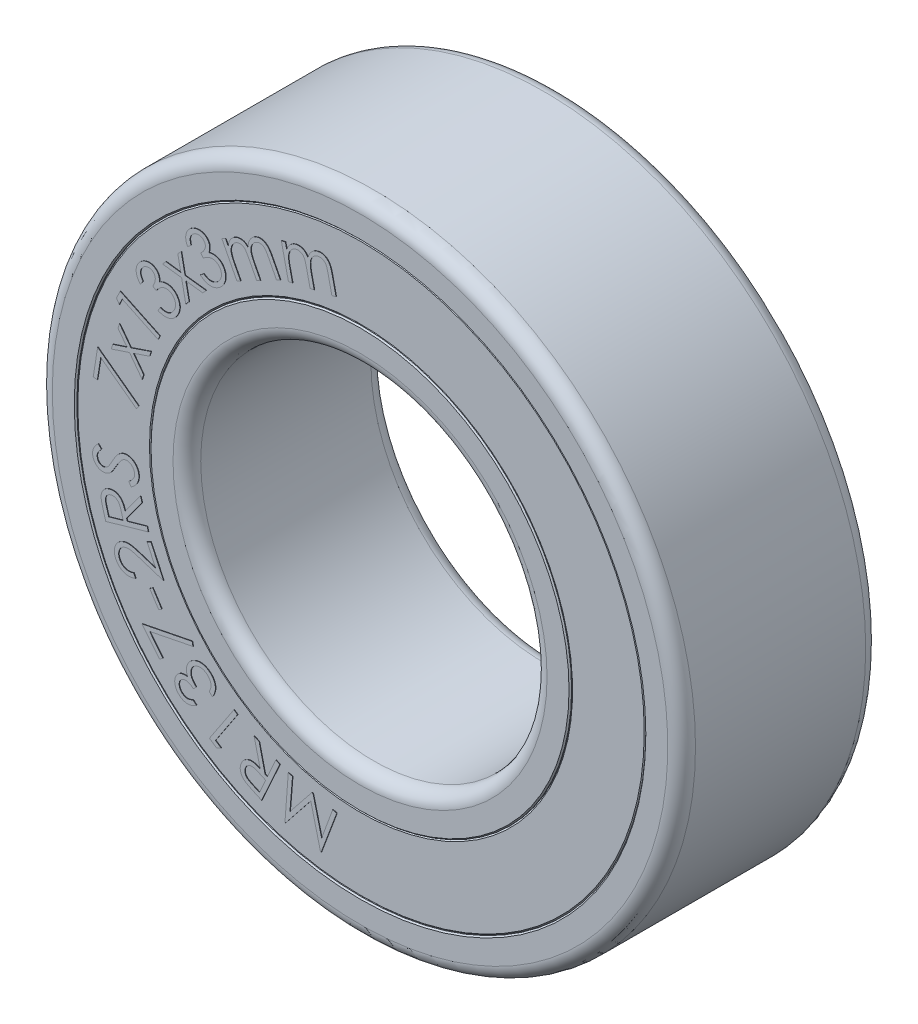
from build123d import *

# Parameters (mm, degrees)
SKETCH_R_INNER_BODY_W           = 4
SKETCH_R_INNER_BODY_H           = 0.75
FILLET_INNER_BODY_R             = 0.28
CHAMFER_INNER_BODY_SIZE         = 0.026
SKETCH_R_OUTER_BODY_W           = 4
SKETCH_R_OUTER_BODY_H           = 0.75
FILLET_OUTER_BODY_R             = 0.28
CHAMFER_OUTER_BODY_SIZE         = 0.026
SKETCH_R_SEAL_FACES_W           = 3.96
SKETCH_R_SEAL_FACES_H           = 1.5
CHAMFER_SEALS_SIZE              = 0.026
BOSS_EXTRUDE_SEAL_LABEL_1_DEPTH = 0.01
BOSS_EXTRUDE_SEAL_LABEL_2_DEPTH = 0.01


with BuildPart() as part:
    # Sketch R, INNER BODY → Revolve INNER BODY (revolve)
    with BuildSketch(Plane(origin=(0, 0, 0), x_dir=(0, 0, -1), z_dir=(1, 0, 0))):
        with Locations((0, 3.875)):
            Rectangle(SKETCH_R_INNER_BODY_W, SKETCH_R_INNER_BODY_H)
    revolve(axis=Axis((0, 0, 17.5), (0, 0, -1)))

    # Fillet INNER BODY
    fillet_inner_body_edges = [part.edges().sort_by_distance(p)[0] for p in [
        (0, -3.5, 2),
        (0, -3.5, -2),
    ]]
    fillet(fillet_inner_body_edges, radius=FILLET_INNER_BODY_R)

    # Chamfer INNER BODY
    chamfer_inner_body_edges = [part.edges().sort_by_distance(p)[0] for p in [
        (0, -4.25, -2),
        (0, -4.25, 2),
    ]]
    chamfer(chamfer_inner_body_edges, length=CHAMFER_INNER_BODY_SIZE)



with BuildPart() as body_2:
    # Sketch R, OUTER BODY → Revolve OUTER BODY (revolve)
    with BuildSketch(Plane(origin=(0, 0, 0), x_dir=(0, 0, -1), z_dir=(1, 0, 0))):
        with Locations((0, 6.125)):
            Rectangle(SKETCH_R_OUTER_BODY_W, SKETCH_R_OUTER_BODY_H)
    revolve(axis=Axis((0, 0, 17.5), (0, 0, -1)))

    # Fillet OUTER BODY
    fillet_outer_body_edges = [body_2.edges().sort_by_distance(p)[0] for p in [
        (0, -6.5, -2),
        (0, -6.5, 2),
    ]]
    fillet(fillet_outer_body_edges, radius=FILLET_OUTER_BODY_R)

    # Chamfer OUTER BODY
    chamfer_outer_body_edges = [body_2.edges().sort_by_distance(p)[0] for p in [
        (0, -5.75, 2),
        (0, -5.75, -2),
    ]]
    chamfer(chamfer_outer_body_edges, length=CHAMFER_OUTER_BODY_SIZE)


with BuildPart() as body_3:
    # Sketch R, SEAL FACES → Revolve SEALS (revolve)
    with BuildSketch(Plane(origin=(0, 0, 0), x_dir=(0, 0, -1), z_dir=(1, 0, 0))):
        with Locations((0, 5)):
            Rectangle(SKETCH_R_SEAL_FACES_W, SKETCH_R_SEAL_FACES_H)
    revolve(axis=Axis((0, 0, 17.5), (0, 0, -1)))

    # Chamfer SEALS
    chamfer_seals_edges = [body_3.edges().sort_by_distance(p)[0] for p in [
        (0, -4.25, -1.98),
        (0, -5.75, -1.98),
        (0, -5.75, 1.98),
        (0, -4.25, 1.98),
    ]]
    chamfer(chamfer_seals_edges, length=CHAMFER_SEALS_SIZE)


with BuildPart() as part_1:
    add(part.part)

    add(body_3.part)  # Boss-Extrude SEAL LABEL 1 merges body 3

    add(body_2.part)  # Boss-Extrude SEAL LABEL 1 merges body 2
    # Sketch TEXT RADIUS 1 — MANUALLY ASSIGN TEXT AND FONT SIZE (FROM EQUATIONS) → Boss-Extrude SEAL LABEL 1 (add)
    # profile 1 of 17: a face of its own
    with BuildSketch(Plane.XY.offset(1.98)):
        with BuildLine():
            Line((-1.601013432, 4.94242738), (-1.518801893, 4.960816803))
            Line((-1.518801893, 4.960816803), (-1.493922085, 4.849578822))
            add(Edge.make_bspline(
                [(-1.493922085, 4.849578822), (-1.488999401, 4.860846674), (-1.479582993, 4.882400498), (-1.463086551, 4.912024507), (-1.445404944, 4.937737324), (-1.431891768, 4.952362173), (-1.42541247, 4.959374495)],
                knots=[0, 0, 0, 0, 1.132709004, 2.166713762, 3.120975974, 4, 4, 4, 4], degree=3))
            add(Edge.make_bspline(
                [(-1.42541247, 4.959374495), (-1.416246773, 4.96751939), (-1.398219148, 4.983539242), (-1.367870433, 5.002617299), (-1.335924627, 5.017770953), (-1.313274299, 5.023665767), (-1.301914874, 5.026622091)],
                knots=[0, 0, 0, 0, 1.032308853, 2.030405018, 3.012223225, 4, 4, 4, 4], degree=3))
            add(Edge.make_bspline(
                [(-1.301914874, 5.026622091), (-1.294185656, 5.028103719), (-1.278818708, 5.031049437), (-1.255415447, 5.032626662), (-1.232096778, 5.031702192), (-1.209102002, 5.028430716), (-1.186955752, 5.023181002), (-1.166226801, 5.015651981), (-1.14692107, 5.006546969), (-1.129035777, 4.994906449), (-1.112123306, 4.980396587), (-1.095550511, 4.962835849), (-1.079263364, 4.941674752), (-1.069219552, 4.925984622), (-1.063934105, 4.917727861)],
                knots=[0, 0, 0, 0, 1.003572602, 1.995266442, 2.985298357, 3.976576977, 4.954956483, 5.884034433, 6.786134005, 7.673145202, 8.598131186, 9.623386984, 10.749333065, 12, 12, 12, 12], degree=3))
            add(Edge.make_bspline(
                [(-1.063934105, 4.917727861), (-1.059589396, 4.931382766), (-1.051148458, 4.957911639), (-1.033085576, 4.994586633), (-1.012132275, 5.027674577), (-0.986982868, 5.056160022), (-0.959271064, 5.080698233), (-0.928789378, 5.100461776), (-0.89618638, 5.11607427), (-0.872954015, 5.122176279), (-0.861289874, 5.12523988)],
                knots=[0, 0, 0, 0, 1.126544146, 2.188660152, 3.20822553, 4.200628457, 5.169445145, 6.112854147, 7.052531474, 8, 8, 8, 8], degree=3))
            add(Edge.make_bspline(
                [(-0.861289874, 5.12523988), (-0.850332234, 5.127332368), (-0.828906174, 5.131423922), (-0.796599568, 5.131542643), (-0.765359818, 5.127490944), (-0.735394801, 5.118588685), (-0.707211169, 5.105395348), (-0.681178451, 5.088153164), (-0.658220571, 5.066281821), (-0.641103692, 5.045080279), (-0.628837588, 5.025523229), (-0.61960587, 5.008794201), (-0.611003667, 4.989886294), (-0.602705788, 4.968944394), (-0.594940508, 4.945891817), (-0.587037623, 4.920959854), (-0.579907297, 4.893855244), (-0.575598381, 4.875012204), (-0.573369201, 4.865263918)],
                knots=[0, 0, 0, 0, 1.210133272, 2.366238299, 3.493139177, 4.623573824, 5.748485634, 6.864335867, 8.001036068, 9.181187922, 9.815358496, 10.508102159, 11.256208296, 12.07122873, 12.95524251, 13.899296218, 14.91321886, 16, 16, 16, 16], degree=3))
            Line((-0.573369201, 4.865263918), (-0.494763432, 4.513881707))
            Line((-0.494763432, 4.513881707), (-0.57931872, 4.495131707))
            Line((-0.57931872, 4.495131707), (-0.657924489, 4.846513918))
            add(Edge.make_bspline(
                [(-0.657924489, 4.846513918), (-0.659806895, 4.854816799), (-0.66340387, 4.870682273), (-0.669214618, 4.893336278), (-0.674993971, 4.913889569), (-0.680579989, 4.932434565), (-0.686650963, 4.948648968), (-0.692305156, 4.962891834), (-0.698247842, 4.974891497), (-0.705842178, 4.988186826), (-0.71676623, 5.002169511), (-0.731893919, 5.016513892), (-0.749447387, 5.028097345), (-0.768949328, 5.037104052), (-0.790089576, 5.043260747), (-0.812515868, 5.046134457), (-0.836057434, 5.045635671), (-0.851764948, 5.042604776), (-0.859847566, 5.041045168)],
                knots=[0, 0, 0, 0, 1.265094215, 2.417392459, 3.474805909, 4.438006383, 5.294067851, 6.046980395, 6.713956198, 7.28221309, 8.320023727, 9.337187848, 10.367556122, 11.430386069, 12.518466311, 13.626159726, 14.778492576, 16, 16, 16, 16], degree=3))
            add(Edge.make_bspline(
                [(-0.859847566, 5.041045168), (-0.869628694, 5.038404434), (-0.888950211, 5.03318796), (-0.916059628, 5.020034104), (-0.940785297, 5.002718237), (-0.962881786, 4.981456335), (-0.981667769, 4.95703514), (-0.996987706, 4.930154634), (-1.00785152, 4.900912283), (-1.013952054, 4.874769772), (-1.016259263, 4.851965803), (-1.01671638, 4.832327528), (-1.015943701, 4.810422046), (-1.013881977, 4.786187243), (-1.010659916, 4.759652392), (-1.00582252, 4.730895595), (-1.000097284, 4.699738571), (-0.995483188, 4.678293061), (-0.993080739, 4.667126899)],
                knots=[0, 0, 0, 0, 1.079561089, 2.132551357, 3.196736933, 4.290141178, 5.392316786, 6.475227011, 7.579659096, 8.711017914, 9.330173797, 10.023242848, 10.806272841, 11.668751668, 12.618775025, 13.658611123, 14.780895041, 16, 16, 16, 16], degree=3))
            Line((-0.993080739, 4.667126899), (-0.936650451, 4.41508363))
            Line((-0.936650451, 4.41508363), (-1.018861989, 4.396694207))
            Line((-1.018861989, 4.396694207), (-1.09259997, 4.726261515))
            add(Edge.make_bspline(
                [(-1.09259997, 4.726261515), (-1.094736784, 4.73558263), (-1.098824471, 4.753413764), (-1.105114187, 4.778920079), (-1.111380734, 4.801956971), (-1.117629417, 4.822543939), (-1.123994074, 4.840605994), (-1.130032959, 4.856367903), (-1.136095572, 4.869688927), (-1.143962099, 4.884108237), (-1.15489101, 4.89940796), (-1.170506309, 4.914715673), (-1.188152751, 4.927505741), (-1.207876949, 4.937391821), (-1.22918814, 4.944350311), (-1.251857967, 4.947544956), (-1.275528267, 4.947209057), (-1.291306302, 4.944285806), (-1.299390835, 4.942787957)],
                knots=[0, 0, 0, 0, 1.335810419, 2.5553822, 3.669347715, 4.67042929, 5.559830211, 6.343958493, 7.027597223, 7.602433961, 8.636855363, 9.640046553, 10.644220713, 11.669128891, 12.709798989, 13.761649994, 14.853088174, 16, 16, 16, 16], degree=3))
            add(Edge.make_bspline(
                [(-1.299390835, 4.942787957), (-1.308758488, 4.940276435), (-1.327389144, 4.935281448), (-1.353413259, 4.922174108), (-1.37775411, 4.905447748), (-1.399631469, 4.884606388), (-1.418807408, 4.860751904), (-1.434072641, 4.834066687), (-1.445503213, 4.805177559), (-1.451656412, 4.779325236), (-1.454570231, 4.757035312), (-1.455378417, 4.738346766), (-1.454932244, 4.71788643), (-1.453446718, 4.695694307), (-1.450947068, 4.671746305), (-1.447070708, 4.646018873), (-1.442025698, 4.618552166), (-1.437963492, 4.599688628), (-1.435869201, 4.589963438)],
                knots=[0, 0, 0, 0, 1.087498972, 2.162849092, 3.255119655, 4.397047257, 5.545746028, 6.68341116, 7.838545269, 9.026235708, 9.659577299, 10.362818237, 11.12615456, 11.958667977, 12.861930403, 13.831448191, 14.881992405, 16, 16, 16, 16], degree=3))
            Line((-1.435869201, 4.589963438), (-1.374931701, 4.317186995))
            Line((-1.374931701, 4.317186995), (-1.457143239, 4.298797572))
            Line((-1.457143239, 4.298797572), (-1.601013432, 4.94242738))
        make_face()
    # profile 2 of 17: a face of its own
    with BuildSketch(Plane.XY.offset(1.98)):
        with BuildLine():
            Line((-2.803042046, 4.37741434), (-2.727861758, 4.416176359))
            Line((-2.727861758, 4.416176359), (-2.675397816, 4.314493667))
            add(Edge.make_bspline(
                [(-2.675397816, 4.314493667), (-2.673515942, 4.326678185), (-2.669897407, 4.350107014), (-2.661159676, 4.383083901), (-2.650637752, 4.412684433), (-2.641174419, 4.430275653), (-2.636635796, 4.438712417)],
                knots=[0, 0, 0, 0, 1.129273917, 2.171408526, 3.123006008, 4, 4, 4, 4], degree=3))
            add(Edge.make_bspline(
                [(-2.636635796, 4.438712417), (-2.629888625, 4.448967417), (-2.616608396, 4.469151984), (-2.591953859, 4.495379791), (-2.564781252, 4.518217298), (-2.544290963, 4.529759508), (-2.534051662, 4.535527321)],
                knots=[0, 0, 0, 0, 1.029964064, 2.027243269, 3.01418423, 4, 4, 4, 4], degree=3))
            add(Edge.make_bspline(
                [(-2.534051662, 4.535527321), (-2.526898767, 4.538909783), (-2.512680885, 4.545633139), (-2.490408786, 4.553244304), (-2.467543377, 4.558276471), (-2.444402537, 4.560979265), (-2.421522527, 4.561281719), (-2.399362199, 4.559668795), (-2.378347015, 4.555206624), (-2.357942235, 4.548648362), (-2.337813277, 4.53900218), (-2.317253874, 4.526131512), (-2.295991957, 4.50984403), (-2.282205884, 4.497124634), (-2.274977143, 4.490455206)],
                knots=[0, 0, 0, 0, 1.004678336, 1.997009522, 2.982473485, 3.974011335, 4.951397589, 5.885978984, 6.790384156, 7.674055595, 8.603006554, 9.617873795, 10.750929726, 12, 12, 12, 12], degree=3))
            add(Edge.make_bspline(
                [(-2.274977143, 4.490455206), (-2.274691187, 4.497730967), (-2.27412762, 4.512070197), (-2.272006768, 4.533219904), (-2.26846201, 4.553583698), (-2.264290975, 4.573273663), (-2.258620899, 4.592179839), (-2.251762902, 4.610260316), (-2.244003854, 4.627789322), (-2.232057803, 4.649822742), (-2.215029205, 4.675597316), (-2.190275231, 4.702383105), (-2.162660501, 4.725869463), (-2.14166254, 4.737655442), (-2.13110695, 4.743580206)],
                knots=[0, 0, 0, 0, 0.855969267, 1.686962932, 2.49656552, 3.285146425, 4.051901859, 4.814348176, 5.55756449, 6.303596535, 7.759592603, 9.17495839, 10.579863116, 12, 12, 12, 12], degree=3))
            add(Edge.make_bspline(
                [(-2.13110695, 4.743580206), (-2.121007779, 4.748322703), (-2.101234223, 4.75760822), (-2.069973676, 4.766323495), (-2.038547741, 4.770140838), (-2.007187238, 4.769234948), (-1.976444254, 4.763704646), (-1.946929209, 4.753235986), (-1.918823489, 4.738274293), (-1.896918677, 4.721879587), (-1.879746776, 4.706298023), (-1.866882848, 4.692013548), (-1.853429088, 4.6760599), (-1.84024947, 4.657666327), (-1.826417951, 4.637560531), (-1.812843814, 4.615027151), (-1.798725971, 4.590654053), (-1.789753388, 4.573425018), (-1.785133393, 4.564553763)],
                knots=[0, 0, 0, 0, 1.206035824, 2.361343885, 3.494931086, 4.620727732, 5.744775355, 6.861875256, 7.996768111, 9.178061744, 9.813402514, 10.503890231, 11.256788531, 12.07123776, 12.951668653, 13.897705946, 14.917525833, 16, 16, 16, 16], degree=3))
            Line((-1.785133393, 4.564553763), (-1.619268008, 4.243279725))
            Line((-1.619268008, 4.243279725), (-1.696611758, 4.203435975))
            Line((-1.696611758, 4.203435975), (-1.862477143, 4.524710013))
            add(Edge.make_bspline(
                [(-1.862477143, 4.524710013), (-1.866391181, 4.532310286), (-1.873902731, 4.546896198), (-1.885499142, 4.567359312), (-1.89631228, 4.585851915), (-1.906558067, 4.602328631), (-1.91640031, 4.616726948), (-1.925770094, 4.628965554), (-1.934412382, 4.639285175), (-1.945382212, 4.649949485), (-1.959411924, 4.660932882), (-1.977887444, 4.670693273), (-1.997801613, 4.677704772), (-2.019050287, 4.681318469), (-2.041110837, 4.682207059), (-2.063605708, 4.679135853), (-2.086283193, 4.672662734), (-2.100783734, 4.665790027), (-2.108210316, 4.662270109)],
                knots=[0, 0, 0, 0, 1.265571299, 2.428796095, 3.481710968, 4.437103545, 5.300892981, 6.062550861, 6.718796846, 7.29135529, 8.325340921, 9.344365052, 10.371436882, 11.437836607, 12.523912924, 13.627523768, 14.784915091, 16, 16, 16, 16], degree=3))
            add(Edge.make_bspline(
                [(-2.108210316, 4.662270109), (-2.117039007, 4.657183903), (-2.134488766, 4.647131103), (-2.157533289, 4.627488117), (-2.17696063, 4.604193224), (-2.193113053, 4.577992249), (-2.20537865, 4.549518514), (-2.212958535, 4.519379852), (-2.21646427, 4.488264393), (-2.215434233, 4.46133281), (-2.211733833, 4.438660756), (-2.207414308, 4.419475265), (-2.200993416, 4.398449825), (-2.192763288, 4.375454602), (-2.182922086, 4.350525481), (-2.171054476, 4.323682852), (-2.157380143, 4.294989875), (-2.147433382, 4.275290982), (-2.142284835, 4.265094629)],
                knots=[0, 0, 0, 0, 1.081417697, 2.137403784, 3.198267252, 4.293912398, 5.398626796, 6.480101097, 7.585554063, 8.717148334, 9.331545179, 10.025833452, 10.805978184, 11.666702905, 12.621647132, 13.65426469, 14.785822897, 16, 16, 16, 16], degree=3))
            Line((-2.142284835, 4.265094629), (-2.02329445, 4.034685975))
            Line((-2.02329445, 4.034685975), (-2.098474739, 3.995923956))
            Line((-2.098474739, 3.995923956), (-2.254063681, 4.297185975))
            add(Edge.make_bspline(
                [(-2.254063681, 4.297185975), (-2.258470165, 4.305680948), (-2.266927102, 4.321984526), (-2.279711551, 4.345048625), (-2.291916772, 4.365732112), (-2.302775763, 4.384447567), (-2.313822763, 4.4002433), (-2.323618209, 4.41402446), (-2.332766627, 4.425520179), (-2.344156054, 4.437378092), (-2.358726204, 4.449377492), (-2.377625459, 4.460516089), (-2.398100748, 4.468351713), (-2.419827495, 4.472837056), (-2.442347065, 4.473946855), (-2.465141584, 4.471315173), (-2.488070317, 4.465191381), (-2.502595015, 4.458304114), (-2.510073296, 4.45475809)],
                knots=[0, 0, 0, 0, 1.331429695, 2.555283997, 3.668110919, 4.673301256, 5.563839167, 6.348235065, 7.025957696, 7.605480864, 8.633230104, 9.641337263, 10.644438962, 11.669327283, 12.715682269, 13.767368696, 14.850492803, 16, 16, 16, 16], degree=3))
            add(Edge.make_bspline(
                [(-2.510073296, 4.45475809), (-2.518474299, 4.449899659), (-2.53522866, 4.440210349), (-2.557435036, 4.42113894), (-2.576524681, 4.398382363), (-2.592578995, 4.372663573), (-2.605053978, 4.344582615), (-2.613234176, 4.314870741), (-2.617071235, 4.283895195), (-2.616330818, 4.257188704), (-2.613577919, 4.234728434), (-2.609428276, 4.216410386), (-2.603987198, 4.1966077), (-2.596956249, 4.175422394), (-2.588187111, 4.152788099), (-2.5779104, 4.128762872), (-2.566217029, 4.103196101), (-2.5573791, 4.085973753), (-2.552801662, 4.077053763)],
                knots=[0, 0, 0, 0, 1.083931526, 2.161715825, 3.254100199, 4.395749721, 5.542554245, 6.679403148, 7.831006039, 9.021286838, 9.658380756, 10.359899608, 11.119959312, 11.955483923, 12.855692869, 13.834696785, 14.8785222, 16, 16, 16, 16], degree=3))
            Line((-2.552801662, 4.077053763), (-2.4240757, 3.827714821))
            Line((-2.4240757, 3.827714821), (-2.499255989, 3.788952802))
            Line((-2.499255989, 3.788952802), (-2.803042046, 4.37741434))
        make_face()
    # profile 3 of 17: a face of its own
    with BuildSketch(Plane.XY.offset(1.98)):
        with BuildLine():
            Line((-3.425679523, 3.949798936), (-3.496532888, 3.892467205))
            add(Edge.make_bspline(
                [(-3.496532888, 3.892467205), (-3.50050429, 3.900826441), (-3.508280353, 3.917193946), (-3.51762179, 3.942246649), (-3.525071063, 3.966857816), (-3.530382571, 3.991205569), (-3.533474762, 4.015156212), (-3.534343836, 4.03880395), (-3.533341948, 4.06210201), (-3.530039756, 4.085022815), (-3.524856005, 4.107284925), (-3.517784807, 4.12870332), (-3.508909781, 4.149154417), (-3.498292372, 4.16868967), (-3.485712046, 4.187109558), (-3.471604308, 4.204759993), (-3.455517213, 4.221390767), (-3.443616005, 4.231506301), (-3.437578561, 4.236637878)],
                knots=[0, 0, 0, 0, 1.168181649, 2.28731676, 3.372541074, 4.412981288, 5.430502677, 6.417775536, 7.397788506, 8.371197619, 9.337600281, 10.280719979, 11.215405789, 12.149321105, 13.083852867, 14.028436943, 14.999832431, 16, 16, 16, 16], degree=3))
            add(Edge.make_bspline(
                [(-3.437578561, 4.236637878), (-3.428429364, 4.243559423), (-3.41026039, 4.257304604), (-3.380228171, 4.273383641), (-3.348839329, 4.286074924), (-3.316133519, 4.294364062), (-3.283170387, 4.298989415), (-3.250663052, 4.299231429), (-3.219044909, 4.295053296), (-3.188773155, 4.286558262), (-3.160321479, 4.27450357), (-3.134288634, 4.259380979), (-3.111174202, 4.240813069), (-3.098256505, 4.226139933), (-3.091785292, 4.218789321)],
                knots=[0, 0, 0, 0, 1.074185811, 2.133176607, 3.182606063, 4.241716767, 5.28798015, 6.296561443, 7.279897109, 8.268256398, 9.235232785, 10.169684628, 11.083090461, 12, 12, 12, 12], degree=3))
            add(Edge.make_bspline(
                [(-3.091785292, 4.218789321), (-3.086090128, 4.211246613), (-3.074912627, 4.196443066), (-3.062231739, 4.171955138), (-3.053360856, 4.146503981), (-3.047916604, 4.11994395), (-3.046876671, 4.092242853), (-3.049265563, 4.063490711), (-3.055429258, 4.033691255), (-3.062285059, 4.014032532), (-3.065823753, 4.003885474)],
                knots=[0, 0, 0, 0, 0.995340814, 1.953486099, 2.893539367, 3.830704074, 4.801385554, 5.806124921, 6.867608226, 8, 8, 8, 8], degree=3))
            add(Edge.make_bspline(
                [(-3.065823753, 4.003885474), (-3.05476632, 4.006891373), (-3.033068837, 4.012789707), (-2.999823903, 4.01637446), (-2.967014428, 4.016324342), (-2.945602689, 4.012715048), (-2.93493433, 4.010916724)],
                knots=[0, 0, 0, 0, 1.037062692, 2.034979485, 3.020932209, 4, 4, 4, 4], degree=3))
            add(Edge.make_bspline(
                [(-2.93493433, 4.010916724), (-2.927566361, 4.009245936), (-2.913021246, 4.005947631), (-2.89208889, 3.99876929), (-2.87213117, 3.990349481), (-2.853300496, 3.980204807), (-2.835535664, 3.968388114), (-2.818812233, 3.955080971), (-2.803113998, 3.940232267), (-2.793788919, 3.929217922), (-2.789080965, 3.923657109)],
                knots=[0, 0, 0, 0, 1.044568202, 2.062082874, 3.056647268, 4.038726437, 5.016467046, 6.004616178, 6.992590401, 8, 8, 8, 8], degree=3))
            add(Edge.make_bspline(
                [(-2.789080965, 3.923657109), (-2.781510206, 3.913576241), (-2.766438887, 3.893507977), (-2.749089641, 3.859768671), (-2.736265178, 3.823680214), (-2.728059447, 3.785622834), (-2.724580942, 3.746735133), (-2.726286112, 3.708004186), (-2.733695589, 3.670046912), (-2.746157942, 3.63314675), (-2.76347633, 3.597697935), (-2.785686034, 3.564555218), (-2.812399444, 3.533697639), (-2.833137501, 3.51566264), (-2.843708369, 3.506469609)],
                knots=[0, 0, 0, 0, 0.967030314, 1.925094047, 2.900462496, 3.901897674, 4.907473884, 5.891835301, 6.869625945, 7.868141512, 8.875644378, 9.890953745, 10.92494992, 12, 12, 12, 12], degree=3))
            add(Edge.make_bspline(
                [(-2.843708369, 3.506469609), (-2.851201394, 3.500711439), (-2.865940186, 3.489385108), (-2.889025594, 3.474552586), (-2.912577153, 3.462230677), (-2.936461356, 3.4522702), (-2.960744089, 3.444538229), (-2.985493562, 3.439644362), (-3.010566334, 3.43659524), (-3.035945206, 3.436273333), (-3.061463564, 3.438514368), (-3.087034028, 3.442967265), (-3.112527281, 3.450224821), (-3.137775388, 3.460288647), (-3.163074277, 3.472630305), (-3.188225329, 3.487649493), (-3.213392443, 3.505135218), (-3.229439261, 3.518427626), (-3.237638657, 3.525219609)],
                knots=[0, 0, 0, 0, 1.045864225, 2.057216695, 3.033290936, 3.984678341, 4.918953529, 5.849264324, 6.773536787, 7.711712439, 8.653184903, 9.605897345, 10.580996112, 11.581723197, 12.611228957, 13.694043653, 14.821732209, 16, 16, 16, 16], degree=3))
            Line((-3.237638657, 3.525219609), (-3.169489619, 3.580387878))
            add(Edge.make_bspline(
                [(-3.169489619, 3.580387878), (-3.163515431, 3.576188694), (-3.151906768, 3.568029106), (-3.134431898, 3.557022754), (-3.11740545, 3.547488208), (-3.100730561, 3.539814648), (-3.084534544, 3.533586436), (-3.068886977, 3.528852288), (-3.053613083, 3.525683641), (-3.043540402, 3.524767496), (-3.038600196, 3.524318167)],
                knots=[0, 0, 0, 0, 1.214590435, 2.360114797, 3.434042068, 4.458337535, 5.410789615, 6.318541787, 7.175318919, 8, 8, 8, 8], degree=3))
            add(Edge.make_bspline(
                [(-3.038600196, 3.524318167), (-3.032466242, 3.524188572), (-3.020228774, 3.523930024), (-3.001932843, 3.525864834), (-2.983773327, 3.529384184), (-2.966019171, 3.5351651), (-2.948317363, 3.542058337), (-2.931146821, 3.55134011), (-2.913969661, 3.562016115), (-2.903130096, 3.570488133), (-2.897614619, 3.574798936)],
                knots=[0, 0, 0, 0, 0.960139297, 1.915514064, 2.875468771, 3.851987477, 4.836098631, 5.846641031, 6.904310009, 8, 8, 8, 8], degree=3))
            add(Edge.make_bspline(
                [(-2.897614619, 3.574798936), (-2.891574586, 3.57992816), (-2.879733078, 3.589984023), (-2.863883726, 3.606422295), (-2.85006848, 3.623488331), (-2.838177351, 3.641115389), (-2.828908245, 3.659715462), (-2.821147384, 3.678686311), (-2.8157144, 3.698479116), (-2.812631217, 3.718752738), (-2.811096243, 3.738956032), (-2.81164603, 3.758707412), (-2.814054462, 3.777695467), (-2.817875456, 3.7961507), (-2.82417401, 3.813761593), (-2.831910443, 3.830828072), (-2.841511165, 3.847264073), (-2.849302658, 3.85739103), (-2.853263657, 3.862539321)],
                knots=[0, 0, 0, 0, 1.169589122, 2.292983976, 3.365708583, 4.409295917, 5.425314445, 6.428893767, 7.432159153, 8.447596179, 9.452900405, 10.420563857, 11.359478393, 12.276797996, 13.197331387, 14.11465099, 15.04153605, 16, 16, 16, 16], degree=3))
            add(Edge.make_bspline(
                [(-2.853263657, 3.862539321), (-2.858959972, 3.86904633), (-2.870274193, 3.88197078), (-2.890644312, 3.897838682), (-2.913139745, 3.910867661), (-2.937714508, 3.920566251), (-2.963423085, 3.927377282), (-2.98980141, 3.929989629), (-3.01634283, 3.929212287), (-3.038535551, 3.92495336), (-3.056829509, 3.919751227), (-3.071577622, 3.914015589), (-3.087380693, 3.907057576), (-3.10411227, 3.898402152), (-3.121827212, 3.888413907), (-3.140436976, 3.876721271), (-3.160162649, 3.863774469), (-3.173428688, 3.854293829), (-3.180306926, 3.849378263)],
                knots=[0, 0, 0, 0, 1.128386011, 2.241240002, 3.357001971, 4.516812585, 5.684869124, 6.82229893, 7.969992605, 9.144189017, 9.765781526, 10.454498111, 11.210706197, 12.022343241, 12.915927263, 13.868616195, 14.894910105, 16, 16, 16, 16], degree=3))
            Line((-3.180306926, 3.849378263), (-3.232049715, 3.913200378))
            add(Edge.make_bspline(
                [(-3.232049715, 3.913200378), (-3.224394556, 3.919656985), (-3.209322786, 3.932369), (-3.189551918, 3.953755088), (-3.172416478, 3.976248603), (-3.158256836, 3.999645131), (-3.147374155, 4.023264998), (-3.139469132, 4.046105023), (-3.135822918, 4.068160823), (-3.135509531, 4.08911017), (-3.138787109, 4.108919909), (-3.144219517, 4.1276706), (-3.152855409, 4.145135285), (-3.160549885, 4.155496178), (-3.164441542, 4.160736436)],
                knots=[0, 0, 0, 0, 1.260961835, 2.482629811, 3.660999322, 4.81949029, 5.920699942, 6.933695977, 7.854987388, 8.72591172, 9.561344388, 10.375922703, 11.178585944, 12, 12, 12, 12], degree=3))
            add(Edge.make_bspline(
                [(-3.164441542, 4.160736436), (-3.167562104, 4.1643401), (-3.173774069, 4.171513756), (-3.184150189, 4.181154084), (-3.195711224, 4.188938305), (-3.207640401, 4.196105252), (-3.22074578, 4.20127421), (-3.234454823, 4.205861301), (-3.249168983, 4.208303617), (-3.264392982, 4.210056806), (-3.279911329, 4.210178557), (-3.295383023, 4.208984906), (-3.310527875, 4.206037021), (-3.325511588, 4.201673061), (-3.340232174, 4.195721281), (-3.354717994, 4.188218854), (-3.369071853, 4.179462196), (-3.378030126, 4.172429569), (-3.38259058, 4.168849417)],
                knots=[0, 0, 0, 0, 0.941832065, 1.874863526, 2.787416533, 3.69181985, 4.618100842, 5.564563305, 6.542825064, 7.557876345, 8.59110416, 9.603930058, 10.619398055, 11.634032448, 12.683712785, 13.751244295, 14.855209233, 16, 16, 16, 16], degree=3))
            add(Edge.make_bspline(
                [(-3.38259058, 4.168849417), (-3.389599232, 4.162693556), (-3.403312883, 4.150648539), (-3.419885705, 4.129206024), (-3.43239431, 4.10581865), (-3.439110454, 4.084727991), (-3.442545411, 4.066964504), (-3.443745768, 4.052709036), (-3.443724461, 4.037573751), (-3.442391192, 4.021618683), (-3.440017181, 4.00483159), (-3.436605896, 3.987163673), (-3.431680806, 3.968728463), (-3.427713207, 3.956213676), (-3.425679523, 3.949798936)],
                knots=[0, 0, 0, 0, 1.395500561, 2.730540285, 4.036024168, 5.351968182, 6.030307938, 6.744647138, 7.492226412, 8.296323188, 9.142116423, 10.032396064, 10.991459616, 12, 12, 12, 12], degree=3))
        make_face()
    # profile 4 of 17: a face of its own
    with BuildSketch(Plane.XY.offset(1.98)):
        Polygon((-4.000864048, 3.335343908), (-3.931272702, 3.41016362), (-3.63271501, 3.371581889), (-3.693111644, 3.666533812), (-3.623520298, 3.741353524), (-3.547438568, 3.361846312), (-3.119794337, 3.312266985), (-3.190106837, 3.236545831), (-3.531212606, 3.277291024), (-3.463604433, 2.942315062), (-3.532654914, 2.868036216), (-3.616489048, 3.287567466), align=None)
    # profile 5 of 17: a face of its own
    with BuildSketch(Plane.XY.offset(1.98)):
        with BuildLine():
            Line((-4.396040593, 2.833296229), (-4.448324247, 2.758115941))
            add(Edge.make_bspline(
                [(-4.448324247, 2.758115941), (-4.454492001, 2.765065457), (-4.466557622, 2.778660393), (-4.482656415, 2.800046863), (-4.496647427, 2.821707818), (-4.508317963, 2.843783236), (-4.518227424, 2.865927522), (-4.525585966, 2.888500545), (-4.531062184, 2.911214848), (-4.534337813, 2.934158614), (-4.535292293, 2.956965255), (-4.534737268, 2.979542039), (-4.531705429, 3.001656006), (-4.527151566, 3.023440479), (-4.520121746, 3.044690405), (-4.511281922, 3.065526559), (-4.500675026, 3.086150048), (-4.492024143, 3.099119879), (-4.487627131, 3.105712095)],
                knots=[0, 0, 0, 0, 1.170875899, 2.290516958, 3.370609084, 4.417790128, 5.43539982, 6.424759294, 7.405935483, 8.37762013, 9.34076285, 10.280595047, 11.220213511, 12.150348232, 13.08223964, 14.036162607, 15.001834241, 16, 16, 16, 16], degree=3))
            add(Edge.make_bspline(
                [(-4.487627131, 3.105712095), (-4.480763034, 3.114976635), (-4.467161896, 3.133334226), (-4.442909677, 3.157350251), (-4.416120999, 3.178127679), (-4.387101676, 3.195447198), (-4.356614774, 3.209245861), (-4.325304635, 3.218495003), (-4.293628518, 3.22329858), (-4.262108204, 3.22352961), (-4.231273935, 3.220103615), (-4.202058899, 3.212342012), (-4.174417745, 3.201375694), (-4.157855321, 3.190839998), (-4.149586266, 3.185579883)],
                knots=[0, 0, 0, 0, 1.076292036, 2.132661559, 3.177426646, 4.237893903, 5.283730227, 6.2966878, 7.279216888, 8.267747063, 9.234678433, 10.169161612, 11.085924632, 12, 12, 12, 12], degree=3))
            add(Edge.make_bspline(
                [(-4.149586266, 3.185579883), (-4.142013512, 3.179900118), (-4.127186388, 3.168779384), (-4.108271028, 3.148698141), (-4.092423641, 3.126833708), (-4.079939568, 3.102668014), (-4.07126799, 3.076278459), (-4.065408048, 3.047923677), (-4.06310789, 3.017451442), (-4.064139113, 2.996575563), (-4.0646704, 2.985820268)],
                knots=[0, 0, 0, 0, 0.994328738, 1.946852507, 2.889101913, 3.82790864, 4.795608465, 5.80246181, 6.867823889, 8, 8, 8, 8], degree=3))
            add(Edge.make_bspline(
                [(-4.0646704, 2.985820268), (-4.054898953, 2.991808163), (-4.03571972, 3.003561103), (-4.004786581, 3.01621895), (-3.973265973, 3.025534828), (-3.951629536, 3.027904675), (-3.940812227, 3.029089499)],
                knots=[0, 0, 0, 0, 1.035866468, 2.033181427, 3.016673489, 4, 4, 4, 4], degree=3))
            add(Edge.make_bspline(
                [(-3.940812227, 3.029089499), (-3.933241657, 3.029524454), (-3.91828048, 3.030384026), (-3.89603917, 3.029320913), (-3.874354193, 3.026966992), (-3.853366207, 3.022381499), (-3.832992676, 3.015999766), (-3.813190635, 3.007904232), (-3.793950312, 2.998017433), (-3.781907861, 2.990023155), (-3.775848285, 2.986000556)],
                knots=[0, 0, 0, 0, 1.04512404, 2.065403774, 3.066722979, 4.050218458, 5.022756994, 6.007787877, 6.997549496, 8, 8, 8, 8], degree=3))
            add(Edge.make_bspline(
                [(-3.775848285, 2.986000556), (-3.765762452, 2.978396952), (-3.745650484, 2.96323475), (-3.719508826, 2.935582604), (-3.697325188, 2.904236906), (-3.678574873, 2.870011603), (-3.664463178, 2.833521944), (-3.655171113, 2.795718417), (-3.651675919, 2.757096591), (-3.653290133, 2.717987253), (-3.660239121, 2.679112145), (-3.671956268, 2.640848193), (-3.689285008, 2.603777278), (-3.704234454, 2.580609038), (-3.711845881, 2.568813056)],
                knots=[0, 0, 0, 0, 0.966183541, 1.926648278, 2.899998381, 3.901078812, 4.908068237, 5.888316388, 6.873093364, 7.868229715, 8.877772461, 9.889673649, 10.925539011, 12, 12, 12, 12], degree=3))
            add(Edge.make_bspline(
                [(-3.711845881, 2.568813056), (-3.717440204, 2.561150966), (-3.728410601, 2.546125701), (-3.746550332, 2.525489093), (-3.765689314, 2.506984568), (-3.785946701, 2.490756256), (-3.80707953, 2.476504421), (-3.829472219, 2.464826866), (-3.852742976, 2.45495298), (-3.877117059, 2.447623959), (-3.902287577, 2.442552721), (-3.928178538, 2.43984014), (-3.954760372, 2.43959944), (-3.981922786, 2.442387925), (-4.009779572, 2.446901105), (-4.038178914, 2.454510862), (-4.067265164, 2.464416526), (-4.086535717, 2.472650569), (-4.09640117, 2.476865941)],
                knots=[0, 0, 0, 0, 1.04712758, 2.053404135, 3.029561494, 3.982989994, 4.916088486, 5.839247623, 6.767235542, 7.703466945, 8.644366457, 9.598487469, 10.573967959, 11.573659152, 12.610029336, 13.686783683, 14.815761694, 16, 16, 16, 16], degree=3))
            Line((-4.09640117, 2.476865941), (-4.046100689, 2.549161614))
            add(Edge.make_bspline(
                [(-4.046100689, 2.549161614), (-4.039209884, 2.546757494), (-4.025763785, 2.542066311), (-4.005881833, 2.536249476), (-3.986765431, 2.532100572), (-3.968588961, 2.529199299), (-3.951246513, 2.527477473), (-3.934783581, 2.527296324), (-3.919179293, 2.528424069), (-3.909245695, 2.530486176), (-3.904393958, 2.531493345)],
                knots=[0, 0, 0, 0, 1.210109745, 2.361299545, 3.432458259, 4.45149818, 5.412355846, 6.31924719, 7.179091842, 8, 8, 8, 8], degree=3))
            add(Edge.make_bspline(
                [(-3.904393958, 2.531493345), (-3.898468072, 2.533123606), (-3.886609496, 2.536385999), (-3.86951927, 2.543291029), (-3.853109072, 2.551795929), (-3.837653096, 2.562181897), (-3.822701404, 2.573990416), (-3.808444244, 2.587497334), (-3.795139081, 2.60289089), (-3.787009831, 2.6140067), (-3.782879535, 2.619654403)],
                knots=[0, 0, 0, 0, 0.959750837, 1.920603675, 2.874085781, 3.842981663, 4.825615025, 5.848569837, 6.906905023, 8, 8, 8, 8], degree=3))
            add(Edge.make_bspline(
                [(-3.782879535, 2.619654403), (-3.778491074, 2.626251214), (-3.769886509, 2.639185748), (-3.759298999, 2.659453637), (-3.750708643, 2.679748237), (-3.744331549, 2.700086063), (-3.740405792, 2.720535673), (-3.73828513, 2.740937875), (-3.738721911, 2.761501389), (-3.741289983, 2.781887026), (-3.74554564, 2.801746461), (-3.751508818, 2.820652058), (-3.759146689, 2.83835862), (-3.768111857, 2.855051569), (-3.778817921, 2.87047465), (-3.791214195, 2.884611634), (-3.805107701, 2.897664068), (-3.815373827, 2.905326797), (-3.820559824, 2.909197672)],
                knots=[0, 0, 0, 0, 1.166287851, 2.286769879, 3.361862911, 4.408935549, 5.419222517, 6.424144472, 7.42449529, 8.441121255, 9.446316037, 10.412079066, 11.355809386, 12.2826187, 13.198458463, 14.114383766, 15.047469465, 16, 16, 16, 16], degree=3))
            add(Edge.make_bspline(
                [(-3.820559824, 2.909197672), (-3.82782512, 2.913819207), (-3.84233473, 2.923048929), (-3.866385431, 2.932690552), (-3.891766231, 2.938873649), (-3.918153098, 2.94150582), (-3.944806886, 2.940727798), (-3.970950538, 2.935898014), (-3.996241099, 2.927582588), (-4.016489259, 2.917386551), (-4.032565948, 2.907110337), (-4.045120213, 2.897464602), (-4.058280434, 2.886256011), (-4.072025135, 2.873409309), (-4.086246127, 2.858758371), (-4.100970294, 2.842392885), (-4.116166505, 2.824231928), (-4.126299334, 2.811445654), (-4.13155742, 2.804810653)],
                knots=[0, 0, 0, 0, 1.121007133, 2.238776653, 3.360304223, 4.518397237, 5.686840002, 6.825974875, 7.973490989, 9.147676167, 9.771630645, 10.459769074, 11.210410426, 12.02554667, 12.912326283, 13.872378353, 14.895943248, 16, 16, 16, 16], degree=3))
            Line((-4.13155742, 2.804810653), (-4.199345881, 2.851865941))
            add(Edge.make_bspline(
                [(-4.199345881, 2.851865941), (-4.193834174, 2.860302493), (-4.183012672, 2.87686654), (-4.169831681, 2.902959172), (-4.15960193, 2.929398485), (-4.152670234, 2.955906278), (-4.148583669, 2.981649979), (-4.147816743, 3.005814932), (-4.149913647, 3.028134607), (-4.155877241, 3.048247273), (-4.164226372, 3.066516959), (-4.174939949, 3.082899137), (-4.187998737, 3.097383994), (-4.198308957, 3.105205328), (-4.203492516, 3.109137576)],
                knots=[0, 0, 0, 0, 1.266349108, 2.486307726, 3.667915741, 4.824443429, 5.925194013, 6.938205662, 7.857794654, 8.730716825, 9.56247268, 10.375657505, 11.183346823, 12, 12, 12, 12], degree=3))
            add(Edge.make_bspline(
                [(-4.203492516, 3.109137576), (-4.207528084, 3.111748783), (-4.215492951, 3.116902438), (-4.228258794, 3.123068726), (-4.24144349, 3.127743958), (-4.255025915, 3.131072818), (-4.269073754, 3.132638296), (-4.28350682, 3.132811588), (-4.298355684, 3.131515853), (-4.313440269, 3.128804625), (-4.328440537, 3.124743545), (-4.342955306, 3.119143847), (-4.356701081, 3.111988841), (-4.370019964, 3.103695749), (-4.382554879, 3.093800373), (-4.394304119, 3.082451631), (-4.405673497, 3.069978513), (-4.412413324, 3.060709501), (-4.415872324, 3.055952479)],
                knots=[0, 0, 0, 0, 0.946184028, 1.867452252, 2.784833091, 3.697926364, 4.615689047, 5.562835359, 6.537115155, 7.547271682, 8.578300849, 9.593991764, 10.605257592, 11.626727342, 12.680611301, 13.744026875, 14.842194399, 16, 16, 16, 16], degree=3))
            add(Edge.make_bspline(
                [(-4.415872324, 3.055952479), (-4.420976341, 3.048057923), (-4.430926828, 3.03266717), (-4.44063342, 3.007268321), (-4.446201337, 2.981367247), (-4.447047208, 2.959196339), (-4.445026578, 2.941209109), (-4.442422262, 2.927096849), (-4.437903247, 2.912644043), (-4.43228844, 2.897667697), (-4.425514832, 2.882086389), (-4.416850611, 2.866288666), (-4.407178707, 2.849786105), (-4.399829448, 2.838905595), (-4.396040593, 2.833296229)],
                knots=[0, 0, 0, 0, 1.403182845, 2.735560841, 4.040474289, 5.353939779, 6.032095221, 6.746248685, 7.497204734, 8.293815391, 9.139167064, 10.036158478, 10.987556234, 12, 12, 12, 12], degree=3))
        make_face()
    # profile 6 of 17: a face of its own
    with BuildSketch(Plane.XY.offset(1.98)):
        Polygon((-4.932526474, 2.273311694), (-4.857165897, 2.431244387), (-4.053259647, 2.047770829), (-4.091300512, 1.96790304), (-4.816420705, 2.313876598), (-4.876637051, 2.187674675), align=None)
    # profile 7 of 17: a face of its own
    with BuildSketch(Plane.XY.offset(1.98)):
        Polygon((-5.037435011, 1.329099639), (-5.006785973, 1.426635697), (-4.720668184, 1.520565985), (-4.902038377, 1.760890504), (-4.871569627, 1.858426562), (-4.6391778, 1.548510697), (-4.231725877, 1.687873677), (-4.262555203, 1.589255889), (-4.588336453, 1.479099639), (-4.382807607, 1.205602043), (-4.413096069, 1.10860685), (-4.669466261, 1.451695793), align=None)
    # profile 8 of 17: a face of its own
    with BuildSketch(Plane.XY.offset(1.98)):
        Polygon((-5.402246886, 0.661064695), (-5.313184386, 1.223384407), (-4.479169962, 0.604814695), (-4.528208424, 0.537747387), (-5.250984866, 1.072663253), (-5.318412751, 0.647723349), align=None)
    # profile 9 of 17: a face of its own
    with BuildSketch(Plane.XY.offset(1.98)):
        with BuildLine():
            Line((-4.632148877, -0.882851704), (-4.687858011, -0.813801223))
            add(Edge.make_bspline(
                [(-4.687858011, -0.813801223), (-4.677192678, -0.805627518), (-4.656770319, -0.789976216), (-4.629828333, -0.764699458), (-4.607454807, -0.73930874), (-4.589798031, -0.713688461), (-4.576696066, -0.687885287), (-4.568374938, -0.661862384), (-4.564629864, -0.635563588), (-4.566134792, -0.618189222), (-4.566884454, -0.609534396)],
                knots=[0, 0, 0, 0, 1.292999825, 2.475881885, 3.550259443, 4.545196945, 5.463722959, 6.325543765, 7.165890392, 8, 8, 8, 8], degree=3))
            add(Edge.make_bspline(
                [(-4.566884454, -0.609534396), (-4.568135885, -0.602217483), (-4.570616009, -0.587716615), (-4.577698886, -0.566797844), (-4.587023299, -0.54688467), (-4.598928517, -0.528398366), (-4.612752168, -0.511724277), (-4.627995144, -0.497084172), (-4.645109942, -0.485481806), (-4.66320956, -0.47626208), (-4.682190921, -0.469837139), (-4.701426512, -0.465776545), (-4.72093573, -0.464376947), (-4.733838583, -0.465713681), (-4.740321954, -0.466385358)],
                knots=[0, 0, 0, 0, 1.067438679, 2.115480636, 3.168334155, 4.226897315, 5.27168342, 6.281742252, 7.25863826, 8.237716338, 9.198225239, 10.135015185, 11.062890385, 12, 12, 12, 12], degree=3))
            add(Edge.make_bspline(
                [(-4.740321954, -0.466385358), (-4.747727178, -0.467812934), (-4.762614037, -0.470682818), (-4.784021427, -0.47980348), (-4.804812802, -0.492204362), (-4.817225722, -0.503129484), (-4.823615223, -0.508753146)],
                knots=[0, 0, 0, 0, 0.951434497, 1.912686109, 2.925563577, 4, 4, 4, 4], degree=3))
            add(Edge.make_bspline(
                [(-4.823615223, -0.508753146), (-4.828180176, -0.513204852), (-4.83780617, -0.522592042), (-4.851732538, -0.53851853), (-4.866197573, -0.556647206), (-4.881098618, -0.576986896), (-4.89643485, -0.599633142), (-4.912250387, -0.624459714), (-4.928509274, -0.651591952), (-4.93922369, -0.670566993), (-4.944769069, -0.680387762)],
                knots=[0, 0, 0, 0, 0.725638547, 1.530134324, 2.406259192, 3.365469305, 4.399627996, 5.519360354, 6.716114104, 8, 8, 8, 8], degree=3))
            add(Edge.make_bspline(
                [(-4.944769069, -0.680387762), (-4.950264551, -0.690142466), (-4.960758338, -0.708769364), (-4.976302369, -0.735133795), (-4.990685155, -0.758683231), (-5.0038358, -0.779566347), (-5.016012049, -0.797571946), (-5.027199514, -0.812674338), (-5.037024211, -0.825214484), (-5.043753851, -0.832118028), (-5.046812338, -0.83525555)],
                knots=[0, 0, 0, 0, 1.445438727, 2.760108309, 3.951026013, 5.007852448, 5.946101169, 6.756125643, 7.43468403, 8, 8, 8, 8], degree=3))
            add(Edge.make_bspline(
                [(-5.046812338, -0.83525555), (-5.05149454, -0.839715738), (-5.060792714, -0.848573025), (-5.075690156, -0.860393597), (-5.091174293, -0.870735155), (-5.107033314, -0.87981493), (-5.123503361, -0.887413269), (-5.140513781, -0.893546059), (-5.158055548, -0.89832528), (-5.170047886, -0.900265391), (-5.176079165, -0.901241127)],
                knots=[0, 0, 0, 0, 1.050201477, 2.08554787, 3.084770428, 4.072961054, 5.051506309, 6.027466623, 7.007958266, 8, 8, 8, 8], degree=3))
            add(Edge.make_bspline(
                [(-5.176079165, -0.901241127), (-5.185562586, -0.902212871), (-5.204275226, -0.904130312), (-5.232276986, -0.902630589), (-5.259383789, -0.897250179), (-5.285594111, -0.888696231), (-5.310238056, -0.876464383), (-5.332849735, -0.860831659), (-5.353617313, -0.842434756), (-5.371647197, -0.820720652), (-5.387233482, -0.7968157), (-5.399392269, -0.770926731), (-5.408752914, -0.743554753), (-5.412033339, -0.724500085), (-5.413699357, -0.714822858)],
                knots=[0, 0, 0, 0, 1.017744605, 2.008208557, 2.98318211, 3.964208771, 4.946580169, 5.912178656, 6.894697023, 7.902113685, 8.919392034, 9.936427035, 10.951980409, 12, 12, 12, 12], degree=3))
            add(Edge.make_bspline(
                [(-5.413699357, -0.714822858), (-5.414763853, -0.704437078), (-5.416872905, -0.683860058), (-5.415040286, -0.652923872), (-5.409489621, -0.622538359), (-5.401255789, -0.597735516), (-5.392483477, -0.577929781), (-5.384073814, -0.562554585), (-5.374134334, -0.546771939), (-5.362786021, -0.530411809), (-5.349468722, -0.513952435), (-5.334935789, -0.496699769), (-5.318487924, -0.479329949), (-5.306821585, -0.467794055), (-5.30083878, -0.461878146)],
                knots=[0, 0, 0, 0, 1.298971154, 2.573610649, 3.845366068, 5.138150888, 5.818556876, 6.542204889, 7.319200162, 8.141757785, 9.021104318, 9.955859807, 10.951711358, 12, 12, 12, 12], degree=3))
            Line((-5.30083878, -0.461878146), (-5.235934934, -0.526781993))
            add(Edge.make_bspline(
                [(-5.235934934, -0.526781993), (-5.240718545, -0.531554774), (-5.249958395, -0.540773705), (-5.262718761, -0.554650209), (-5.274101282, -0.56785237), (-5.284270697, -0.580304712), (-5.293113583, -0.592118108), (-5.300500226, -0.603358015), (-5.306786977, -0.613786796), (-5.31293265, -0.626941056), (-5.318552561, -0.643195169), (-5.322557045, -0.663075189), (-5.323937737, -0.683415537), (-5.322604977, -0.696980858), (-5.32193253, -0.703825262)],
                knots=[0, 0, 0, 0, 1.185605156, 2.290071986, 3.306892114, 4.243980235, 5.110795045, 5.894613536, 6.603568391, 7.24508648, 8.438963237, 9.611553879, 10.794905923, 12, 12, 12, 12], degree=3))
            add(Edge.make_bspline(
                [(-5.32193253, -0.703825262), (-5.320406461, -0.712393134), (-5.317468774, -0.728886301), (-5.307664275, -0.751544596), (-5.294706089, -0.771452004), (-5.277756476, -0.787601905), (-5.258564656, -0.800116975), (-5.2375204, -0.808257703), (-5.215107242, -0.811872925), (-5.1999993, -0.810522581), (-5.192305127, -0.809834877)],
                knots=[0, 0, 0, 0, 1.112389705, 2.141352022, 3.141493508, 4.138692214, 5.119714273, 6.061270491, 7.012643836, 8, 8, 8, 8], degree=3))
            add(Edge.make_bspline(
                [(-5.192305127, -0.809834877), (-5.187537791, -0.809029319), (-5.17800607, -0.807418702), (-5.164049933, -0.803273873), (-5.150705557, -0.797321179), (-5.137372784, -0.790336911), (-5.124407632, -0.78079638), (-5.111185951, -0.769029561), (-5.097949087, -0.75447769), (-5.089357601, -0.743720117), (-5.084853204, -0.738080069)],
                knots=[0, 0, 0, 0, 0.872231268, 1.743922789, 2.618444266, 3.506649223, 4.454887141, 5.515132597, 6.697218112, 8, 8, 8, 8], degree=3))
            add(Edge.make_bspline(
                [(-5.084853204, -0.738080069), (-5.083390949, -0.735989814), (-5.079901632, -0.731001926), (-5.074369556, -0.721844649), (-5.067407098, -0.710061497), (-5.059048639, -0.695518902), (-5.049432567, -0.678264246), (-5.038113283, -0.658424403), (-5.025787419, -0.635671216), (-5.017010726, -0.619627146), (-5.012377242, -0.611156993)],
                knots=[0, 0, 0, 0, 0.418657864, 0.999025515, 1.755301382, 2.665676174, 3.752273415, 4.997937778, 6.415119947, 8, 8, 8, 8], degree=3))
            add(Edge.make_bspline(
                [(-5.012377242, -0.611156993), (-5.00674764, -0.600894584), (-4.995853009, -0.581034362), (-4.978719867, -0.552921444), (-4.962359528, -0.526871505), (-4.945752268, -0.503518618), (-4.9301247, -0.482012221), (-4.914088077, -0.463336136), (-4.898765959, -0.446644035), (-4.878682761, -0.428093699), (-4.85340079, -0.408633035), (-4.821757039, -0.390332159), (-4.789165959, -0.377162433), (-4.766622366, -0.373048587), (-4.755466184, -0.371012762)],
                knots=[0, 0, 0, 0, 1.153671201, 2.232630556, 3.244933926, 4.184994293, 5.05701876, 5.864083256, 6.610138261, 7.289212006, 8.55701565, 9.7459077, 10.884513995, 12, 12, 12, 12], degree=3))
            add(Edge.make_bspline(
                [(-4.755466184, -0.371012762), (-4.747544398, -0.370131184), (-4.731852663, -0.368384926), (-4.708326844, -0.368596249), (-4.685254911, -0.371350601), (-4.662659331, -0.376412958), (-4.640499736, -0.3838064), (-4.618958637, -0.393896854), (-4.597812442, -0.406166635), (-4.577470775, -0.420712856), (-4.558238512, -0.436889295), (-4.54109132, -0.454883634), (-4.525822147, -0.473998297), (-4.512816578, -0.494539683), (-4.501731199, -0.51623245), (-4.492864643, -0.539312651), (-4.48616168, -0.56372869), (-4.483380573, -0.580597439), (-4.481968588, -0.5891618)],
                knots=[0, 0, 0, 0, 0.9838653, 1.948872787, 2.898135624, 3.84899335, 4.804360276, 5.777470164, 6.781980084, 7.820047598, 8.862696343, 9.881178698, 10.885112503, 11.879700005, 12.87893023, 13.889374096, 14.928423109, 16, 16, 16, 16], degree=3))
            add(Edge.make_bspline(
                [(-4.481968588, -0.5891618), (-4.481146761, -0.5958236), (-4.479514694, -0.609053278), (-4.478858791, -0.628887731), (-4.479552974, -0.648409354), (-4.481713857, -0.66764136), (-4.485413646, -0.686586021), (-4.49014198, -0.705404342), (-4.496781927, -0.723762724), (-4.504515799, -0.741960842), (-4.513970455, -0.759971287), (-4.525368832, -0.777773476), (-4.538629288, -0.795491395), (-4.553657326, -0.813155026), (-4.570411504, -0.830894285), (-4.589289455, -0.848293815), (-4.609843375, -0.86589639), (-4.624577514, -0.877096405), (-4.632148877, -0.882851704)],
                knots=[0, 0, 0, 0, 0.924206432, 1.835382863, 2.73001453, 3.613082182, 4.497894071, 5.387340537, 6.282737828, 7.183818543, 8.109506669, 9.080888141, 10.092459158, 11.155555625, 12.273937119, 13.451182812, 14.690251321, 16, 16, 16, 16], degree=3))
        make_face()
    # profile 10 of 17: a face of its own
    with BuildSketch(Plane.XY.offset(1.98)):
        with BuildLine():
            Line((-5.150000949, -1.744808274), (-5.199219699, -1.573173658))
            add(Edge.make_bspline(
                [(-5.199219699, -1.573173658), (-5.202498838, -1.561704787), (-5.20878751, -1.539709996), (-5.217279083, -1.507979161), (-5.224463433, -1.478986535), (-5.230573766, -1.452839949), (-5.23582197, -1.429578835), (-5.239340465, -1.408976015), (-5.242001572, -1.39119101), (-5.242956247, -1.380210262), (-5.243390372, -1.375216928)],
                knots=[0, 0, 0, 0, 1.409461677, 2.703039634, 3.881062718, 4.938640349, 5.876003958, 6.697885572, 7.407882618, 8, 8, 8, 8], degree=3))
            add(Edge.make_bspline(
                [(-5.243390372, -1.375216928), (-5.243630491, -1.368485304), (-5.244104741, -1.355189918), (-5.242725903, -1.335475924), (-5.240044852, -1.316311374), (-5.235940466, -1.297644367), (-5.230101633, -1.279581797), (-5.222871545, -1.262037322), (-5.214197668, -1.244993067), (-5.203947681, -1.22863842), (-5.192271004, -1.213225533), (-5.179371724, -1.198800564), (-5.16517876, -1.185712756), (-5.149698943, -1.173834043), (-5.132904175, -1.163466526), (-5.114916538, -1.154164341), (-5.095653835, -1.146251315), (-5.082187046, -1.142063196), (-5.075361526, -1.139940485)],
                knots=[0, 0, 0, 0, 1.029558536, 2.033443641, 3.017398206, 3.987388515, 4.952402019, 5.916758769, 6.886836162, 7.873748191, 8.864547144, 9.840787679, 10.829410129, 11.812892392, 12.820263584, 13.843814973, 14.907156994, 16, 16, 16, 16], degree=3))
            add(Edge.make_bspline(
                [(-5.075361526, -1.139940485), (-5.063885176, -1.137020571), (-5.041403564, -1.131300601), (-5.007297166, -1.128574173), (-4.974163453, -1.130301898), (-4.942176626, -1.136780055), (-4.911723258, -1.147945304), (-4.883474614, -1.163916896), (-4.857345033, -1.184185603), (-4.837816935, -1.204772105), (-4.823237903, -1.223613758), (-4.812686101, -1.239706645), (-4.802381552, -1.257362883), (-4.792660886, -1.276789948), (-4.783305023, -1.29791681), (-4.774313233, -1.320762945), (-4.765865371, -1.345333058), (-4.760703817, -1.362339201), (-4.758053833, -1.371070293)],
                knots=[0, 0, 0, 0, 1.272068148, 2.491919645, 3.663905451, 4.831675211, 5.989433508, 7.138603485, 8.308965412, 9.534457673, 10.179748116, 10.870103129, 11.603069785, 12.37795037, 13.205723231, 14.088146062, 15.018438695, 16, 16, 16, 16], degree=3))
            Line((-4.758053833, -1.371070293), (-4.446154795, -0.946310678))
            Line((-4.446154795, -0.946310678), (-4.415686045, -1.052861158))
            Line((-4.415686045, -1.052861158), (-4.727765372, -1.477079908))
            Line((-4.727765372, -1.477079908), (-4.713522583, -1.526298658))
            Line((-4.713522583, -1.526298658), (-4.312741333, -1.411454908))
            Line((-4.312741333, -1.411454908), (-4.288041814, -1.497632793))
            Line((-4.288041814, -1.497632793), (-5.150000949, -1.744808274))
        make_face()
        with BuildLine():
            Line((-5.090325468, -1.634291447), (-4.797356718, -1.550457312))
            Line((-4.797356718, -1.550457312), (-4.838642776, -1.40189962))
            add(Edge.make_bspline(
                [(-4.838642776, -1.40189962), (-4.840722094, -1.394981347), (-4.844748763, -1.381583885), (-4.850973229, -1.362295354), (-4.857494744, -1.344648062), (-4.863971082, -1.328501677), (-4.870559265, -1.313894014), (-4.877489504, -1.300905814), (-4.884218802, -1.289284837), (-4.893522894, -1.276224842), (-4.906063721, -1.262137121), (-4.922971527, -1.247960813), (-4.941969627, -1.2371421), (-4.962382861, -1.229198313), (-4.983778713, -1.224312), (-5.005691843, -1.222777536), (-5.027924395, -1.223993282), (-5.042410506, -1.227675528), (-5.049760564, -1.229543851)],
                knots=[0, 0, 0, 0, 1.116406098, 2.161956872, 3.131576784, 4.023203494, 4.850240362, 5.606340864, 6.297603621, 6.923789099, 8.081461914, 9.202801746, 10.317893652, 11.444107312, 12.577383139, 13.694986125, 14.830466993, 16, 16, 16, 16], degree=3))
            add(Edge.make_bspline(
                [(-5.049760564, -1.229543851), (-5.05675, -1.231872103), (-5.070533081, -1.236463386), (-5.089755468, -1.246733345), (-5.10695998, -1.259887051), (-5.122201019, -1.275295478), (-5.135005287, -1.292513738), (-5.144886569, -1.311188579), (-5.151837394, -1.330969958), (-5.154919693, -1.348543206), (-5.155513167, -1.363552568), (-5.155398982, -1.376326303), (-5.154009533, -1.390523461), (-5.151819448, -1.406215108), (-5.14881365, -1.423323472), (-5.144454178, -1.441767624), (-5.139751385, -1.461796025), (-5.135818158, -1.475532991), (-5.133774987, -1.482668851)],
                knots=[0, 0, 0, 0, 1.160791146, 2.289065505, 3.41925044, 4.565703547, 5.697795834, 6.792054185, 7.886517895, 8.993233446, 9.591232017, 10.254990536, 11.006947663, 11.839630135, 12.754661274, 13.74603506, 14.829146176, 16, 16, 16, 16], degree=3))
            Line((-5.133774987, -1.482668851), (-5.090325468, -1.634291447))
        make_face(mode=Mode.SUBTRACT)
    # profile 11 of 17: a face of its own
    with BuildSketch(Plane.XY.offset(1.98)):
        with BuildLine():
            Line((-4.582782158, -2.362362088), (-4.546544177, -2.440246704))
            add(Edge.make_bspline(
                [(-4.546544177, -2.440246704), (-4.556574924, -2.444335327), (-4.576296978, -2.452374213), (-4.606507812, -2.461112448), (-4.636399032, -2.467247656), (-4.666067958, -2.470088319), (-4.69547368, -2.470125034), (-4.724581459, -2.467215591), (-4.75347692, -2.461445764), (-4.781730717, -2.452554141), (-4.809034677, -2.441379677), (-4.834563759, -2.427527268), (-4.858367486, -2.411696213), (-4.880057935, -2.393299564), (-4.900055285, -2.372829278), (-4.918053655, -2.350020634), (-4.934326604, -2.325036394), (-4.943182117, -2.306994747), (-4.947686004, -2.297818819)],
                knots=[0, 0, 0, 0, 1.09558072, 2.154086804, 3.177484267, 4.179661736, 5.164939625, 6.14895902, 7.135381305, 8.141481999, 9.142200465, 10.116397176, 11.076210988, 12.030148886, 12.989268745, 13.967614339, 14.96633477, 16, 16, 16, 16], degree=3))
            add(Edge.make_bspline(
                [(-4.947686004, -2.297818819), (-4.951689863, -2.288626463), (-4.959550786, -2.270578777), (-4.968452073, -2.24290436), (-4.974250036, -2.215405462), (-4.977136693, -2.188218976), (-4.977380161, -2.161396525), (-4.974710871, -2.13482513), (-4.968758038, -2.108597091), (-4.960427865, -2.08276582), (-4.949362168, -2.058165929), (-4.936834125, -2.034844981), (-4.922056819, -2.013515879), (-4.905716735, -1.993772104), (-4.887350047, -1.975996218), (-4.867165385, -1.960121856), (-4.845398277, -1.945669037), (-4.829631293, -1.937914836), (-4.821664369, -1.933996704)],
                knots=[0, 0, 0, 0, 1.11891976, 2.196815698, 3.238997524, 4.251114701, 5.244126621, 6.228853435, 7.22512396, 8.241435517, 9.253752821, 10.232587749, 11.192874236, 12.145559918, 13.089773529, 14.040164748, 15.009711775, 16, 16, 16, 16], degree=3))
            add(Edge.make_bspline(
                [(-4.821664369, -1.933996704), (-4.810118983, -1.929050252), (-4.787210254, -1.919235342), (-4.75098925, -1.910202775), (-4.714055834, -1.905563681), (-4.682477335, -1.905881895), (-4.655851157, -1.908294148), (-4.633473436, -1.91160168), (-4.608869377, -1.916420193), (-4.581952074, -1.922105095), (-4.552925528, -1.929380865), (-4.521711359, -1.938128659), (-4.488167866, -1.948027237), (-4.46510233, -1.955293166), (-4.453154754, -1.9590568)],
                knots=[0, 0, 0, 0, 1.190936502, 2.363094793, 3.530131304, 4.716960171, 5.352873647, 6.067813609, 6.863466639, 7.733022744, 8.679590818, 9.703992096, 10.81070485, 12, 12, 12, 12], degree=3))
            Line((-4.453154754, -1.9590568), (-4.14071485, -2.059477473))
            Line((-4.14071485, -2.059477473), (-4.315414369, -1.684657762))
            Line((-4.315414369, -1.684657762), (-4.236988888, -1.648059204))
            Line((-4.236988888, -1.648059204), (-3.979897542, -2.199561608))
            Line((-3.979897542, -2.199561608), (-4.459645138, -2.045595262))
            add(Edge.make_bspline(
                [(-4.459645138, -2.045595262), (-4.47129305, -2.041835011), (-4.493705207, -2.03459978), (-4.526116727, -2.024739749), (-4.555877221, -2.015962627), (-4.583131548, -2.008775262), (-4.607772165, -2.002798773), (-4.629827225, -1.998069368), (-4.649230206, -1.994527538), (-4.671462405, -1.991885506), (-4.69721073, -1.99102702), (-4.727026546, -1.993923428), (-4.756013263, -2.000619328), (-4.774163717, -2.008360887), (-4.783262927, -2.012241896)],
                knots=[0, 0, 0, 0, 1.320672771, 2.541153087, 3.655448185, 4.668378718, 5.582162831, 6.391036403, 7.102116287, 7.709377645, 8.805736035, 9.874241537, 10.934311934, 12, 12, 12, 12], degree=3))
            add(Edge.make_bspline(
                [(-4.783262927, -2.012241896), (-4.788790931, -2.015020589), (-4.799713727, -2.020511014), (-4.814877659, -2.030489647), (-4.828752173, -2.041748135), (-4.841185916, -2.054450261), (-4.852441413, -2.0683433), (-4.862226887, -2.083671393), (-4.870702717, -2.100264473), (-4.87766424, -2.118028031), (-4.883011971, -2.136379911), (-4.886658613, -2.154956817), (-4.888610891, -2.17355941), (-4.888031574, -2.192217188), (-4.88622547, -2.210846075), (-4.882048596, -2.229391091), (-4.876412946, -2.248054248), (-4.871074182, -2.260128043), (-4.868359081, -2.266268338)],
                knots=[0, 0, 0, 0, 0.995713027, 1.967431737, 2.916672312, 3.867933546, 4.824692878, 5.791143996, 6.790987461, 7.820781404, 8.859044823, 9.865005595, 10.866533875, 11.863562988, 12.866072769, 13.875936591, 14.919778241, 16, 16, 16, 16], degree=3))
            add(Edge.make_bspline(
                [(-4.868359081, -2.266268338), (-4.86523146, -2.27258327), (-4.859127465, -2.284907755), (-4.84808421, -2.302082594), (-4.835957425, -2.317718716), (-4.822422132, -2.331723891), (-4.807877093, -2.344294668), (-4.791733379, -2.354880009), (-4.77467869, -2.364400695), (-4.756244537, -2.371891241), (-4.736918228, -2.377637574), (-4.716838888, -2.381716098), (-4.695977856, -2.383422268), (-4.67449737, -2.383230716), (-4.652417236, -2.381034915), (-4.629715176, -2.376767784), (-4.606303751, -2.370717271), (-4.590736636, -2.365187625), (-4.582782158, -2.362362088)],
                knots=[0, 0, 0, 0, 1.007692543, 1.966654777, 2.916201708, 3.834552896, 4.749556328, 5.660631732, 6.591936101, 7.540509078, 8.500896821, 9.473982181, 10.466629003, 11.489977232, 12.544149873, 13.637102118, 14.792607362, 16, 16, 16, 16], degree=3))
        make_face()
    # profile 12 of 17: a face of its own
    with BuildSketch(Plane.XY.offset(1.98)):
        Polygon((-4.079890974, -2.75568359), (-4.261621743, -2.473712436), (-4.199061647, -2.433327821), (-4.017330877, -2.715298975), align=None)
    # profile 13 of 17: a face of its own
    with BuildSketch(Plane.XY.offset(1.98)):
        Polygon((-4.060697859, -3.613308708), (-4.41568584, -3.171782266), (-3.402644975, -2.970580342), (-3.386058436, -3.051349573), (-4.26334209, -3.226770246), (-3.995072859, -3.560484189), align=None)
    # profile 14 of 17: a face of its own
    with BuildSketch(Plane.XY.offset(1.98)):
        with BuildLine():
            Line((-3.383545741, -3.986235134), (-3.315937568, -4.047713499))
            add(Edge.make_bspline(
                [(-3.315937568, -4.047713499), (-3.323609796, -4.052949928), (-3.338618862, -4.063193875), (-3.362069718, -4.076106806), (-3.38526617, -4.087181531), (-3.408508387, -4.096135885), (-3.431741817, -4.102810988), (-3.455032284, -4.10732126), (-3.478247315, -4.109976855), (-3.501370497, -4.110038339), (-3.524118274, -4.108298299), (-3.546302357, -4.104457601), (-3.567878085, -4.098918489), (-3.588748949, -4.09126166), (-3.608932329, -4.081672751), (-3.628512486, -4.070274113), (-3.647396574, -4.05686583), (-3.659170388, -4.046615021), (-3.665156318, -4.041403403)],
                knots=[0, 0, 0, 0, 1.17172719, 2.292232233, 3.374530358, 4.414072954, 5.43194584, 6.421127556, 7.405295115, 8.376162501, 9.334835986, 10.281249636, 11.213948197, 12.142536095, 13.082331494, 14.030657922, 14.998766103, 16, 16, 16, 16], degree=3))
            add(Edge.make_bspline(
                [(-3.665156318, -4.041403403), (-3.673434283, -4.033373715), (-3.689816177, -4.017483158), (-3.710293869, -3.990232085), (-3.727773693, -3.961255236), (-3.740869375, -3.930164245), (-3.750324792, -3.898240896), (-3.755436087, -3.866118706), (-3.75627014, -3.834199578), (-3.752378333, -3.802922484), (-3.744700658, -3.772928739), (-3.733436167, -3.744931591), (-3.718893551, -3.719028819), (-3.706271517, -3.704024068), (-3.699951991, -3.696511576)],
                knots=[0, 0, 0, 0, 1.078355889, 2.134040123, 3.181111055, 4.239910028, 5.283391329, 6.291765358, 7.276757304, 8.262970049, 9.233339444, 10.167498479, 11.082513792, 12, 12, 12, 12], degree=3))
            add(Edge.make_bspline(
                [(-3.699951991, -3.696511576), (-3.693338945, -3.6897632), (-3.680399131, -3.676558584), (-3.658173243, -3.660341845), (-3.634417329, -3.647575164), (-3.60888697, -3.638481152), (-3.581676662, -3.633118248), (-3.552912921, -3.631195142), (-3.522452522, -3.632813778), (-3.501961795, -3.63665251), (-3.491358241, -3.63863898)],
                knots=[0, 0, 0, 0, 0.994972268, 1.946872235, 2.888144173, 3.830247747, 4.793450919, 5.803486028, 6.863346628, 8, 8, 8, 8], degree=3))
            add(Edge.make_bspline(
                [(-3.491358241, -3.63863898), (-3.495981983, -3.628228752), (-3.50508678, -3.60772955), (-3.513482406, -3.575437777), (-3.518627414, -3.543014136), (-3.518236113, -3.521289898), (-3.518040933, -3.510453884)],
                knots=[0, 0, 0, 0, 1.031922228, 2.031999769, 3.018364666, 4, 4, 4, 4], degree=3))
            add(Edge.make_bspline(
                [(-3.518040933, -3.510453884), (-3.517516471, -3.502926128), (-3.516478723, -3.488031045), (-3.512561576, -3.466222184), (-3.507213373, -3.4451391), (-3.499942234, -3.424960185), (-3.491137955, -3.405529789), (-3.480393345, -3.387138421), (-3.468124453, -3.36944325), (-3.458652068, -3.358566574), (-3.453858241, -3.353062057)],
                knots=[0, 0, 0, 0, 1.043086543, 2.063943017, 3.059926059, 4.048527736, 5.026800823, 6.006309215, 6.991024052, 8, 8, 8, 8], degree=3))
            add(Edge.make_bspline(
                [(-3.453858241, -3.353062057), (-3.445024598, -3.344076514), (-3.42737103, -3.326119381), (-3.396506969, -3.304025778), (-3.362777004, -3.285766759), (-3.326404671, -3.271888191), (-3.28845823, -3.262419035), (-3.24986663, -3.25847295), (-3.211188513, -3.259616176), (-3.172874572, -3.266711155), (-3.13516709, -3.278339517), (-3.099072379, -3.295293723), (-3.064416531, -3.316889566), (-3.043545119, -3.33474657), (-3.032884683, -3.343867346)],
                knots=[0, 0, 0, 0, 0.96582956, 1.930159383, 2.900375526, 3.903680598, 4.910744233, 5.894067656, 6.872671803, 7.870872371, 8.87625433, 9.893841294, 10.924242848, 12, 12, 12, 12], degree=3))
            add(Edge.make_bspline(
                [(-3.032884683, -3.343867346), (-3.026049287, -3.350375616), (-3.012610998, -3.36317078), (-2.994578709, -3.383793696), (-2.978708571, -3.405125475), (-2.965449008, -3.427384826), (-2.95405622, -3.450204255), (-2.945282722, -3.473856926), (-2.938684217, -3.49822809), (-2.934611232, -3.523238691), (-2.932743785, -3.548826537), (-2.93350113, -3.574793504), (-2.936785702, -3.601044977), (-2.942606257, -3.62760863), (-2.951194311, -3.654376782), (-2.962039308, -3.681603301), (-2.975618806, -3.709051948), (-2.986306353, -3.726989904), (-2.991778914, -3.736175038)],
                knots=[0, 0, 0, 0, 1.044447219, 2.053367954, 3.028760465, 3.983790889, 4.918086595, 5.848631906, 6.771774573, 7.709144795, 8.649603017, 9.608034071, 10.580153597, 11.574579623, 12.614056391, 13.688914534, 14.816608229, 16, 16, 16, 16], degree=3))
            Line((-2.991778914, -3.736175038), (-3.05668276, -3.677220711))
            add(Edge.make_bspline(
                [(-3.05668276, -3.677220711), (-3.053450083, -3.670693129), (-3.047159913, -3.657991702), (-3.038764855, -3.639066859), (-3.032047638, -3.620699759), (-3.027105782, -3.602994861), (-3.023084741, -3.586137113), (-3.020994512, -3.569830155), (-3.020126251, -3.554198292), (-3.02082626, -3.544046033), (-3.021165933, -3.539119749)],
                knots=[0, 0, 0, 0, 1.209620672, 2.353690442, 3.436574286, 4.453769418, 5.405294507, 6.311459528, 7.180652278, 8, 8, 8, 8], degree=3))
            add(Edge.make_bspline(
                [(-3.021165933, -3.539119749), (-3.021934252, -3.533025807), (-3.023463596, -3.520895771), (-3.028139687, -3.503100219), (-3.034362531, -3.485781239), (-3.042663696, -3.469095926), (-3.052424162, -3.452773407), (-3.0639386, -3.436905443), (-3.077420011, -3.421716202), (-3.087324969, -3.412190328), (-3.092379875, -3.407328884)],
                knots=[0, 0, 0, 0, 0.960750635, 1.912381258, 2.873822765, 3.837471737, 4.825032402, 5.848861977, 6.902186058, 8, 8, 8, 8], degree=3))
            add(Edge.make_bspline(
                [(-3.092379875, -3.407328884), (-3.098362728, -3.402113066), (-3.110067299, -3.391909086), (-3.128741711, -3.378724246), (-3.147688246, -3.367689142), (-3.166961847, -3.358689442), (-3.186624631, -3.352046769), (-3.206672723, -3.34745201), (-3.227051368, -3.345109613), (-3.247580116, -3.345036428), (-3.267740243, -3.346571281), (-3.28719358, -3.349994711), (-3.30565089, -3.355267855), (-3.323225152, -3.362136885), (-3.339943014, -3.370635784), (-3.355680669, -3.380944133), (-3.370379478, -3.393100911), (-3.379244359, -3.402311742), (-3.383726029, -3.406968307)],
                knots=[0, 0, 0, 0, 1.17060525, 2.29011666, 3.36695058, 4.402500485, 5.423250869, 6.423574454, 7.432235354, 8.443193491, 9.44841825, 10.412106495, 11.352460422, 12.276278623, 13.192403903, 14.114731283, 15.046896196, 16, 16, 16, 16], degree=3))
            add(Edge.make_bspline(
                [(-3.383726029, -3.406968307), (-3.389300438, -3.413597084), (-3.400359488, -3.42674789), (-3.412951534, -3.449351344), (-3.422461447, -3.473599793), (-3.428487349, -3.499402264), (-3.431067683, -3.52591345), (-3.429732619, -3.552431237), (-3.424871967, -3.578541141), (-3.417595808, -3.599969989), (-3.409469693, -3.6171469), (-3.401587237, -3.63087252), (-3.392289095, -3.645437953), (-3.381112657, -3.660600384), (-3.368592087, -3.676623628), (-3.354188708, -3.693267807), (-3.338205598, -3.710654383), (-3.326842631, -3.722379156), (-3.320985644, -3.728422634)],
                knots=[0, 0, 0, 0, 1.128933905, 2.239687952, 3.36048978, 4.521753854, 5.68852158, 6.827883654, 7.977766823, 9.146776181, 9.771708377, 10.457051714, 11.212510859, 12.027284953, 12.915972759, 13.867718157, 14.900925662, 16, 16, 16, 16], degree=3))
            Line((-3.320985644, -3.728422634), (-3.376334202, -3.789360134))
            add(Edge.make_bspline(
                [(-3.376334202, -3.789360134), (-3.383966705, -3.782778429), (-3.398938041, -3.769868257), (-3.423039781, -3.753418961), (-3.447921391, -3.739913063), (-3.473301019, -3.729602344), (-3.498231394, -3.722188482), (-3.522016072, -3.717981473), (-3.544359031, -3.717511052), (-3.565087976, -3.720633069), (-3.58422881, -3.72661284), (-3.601677876, -3.73527712), (-3.617922406, -3.745975409), (-3.626911995, -3.755282651), (-3.631442375, -3.759973115)],
                knots=[0, 0, 0, 0, 1.268494305, 2.488181957, 3.666666109, 4.827593766, 5.931694423, 6.937058778, 7.860545876, 8.732901232, 9.565923166, 10.374908701, 11.181021397, 12, 12, 12, 12], degree=3))
            add(Edge.make_bspline(
                [(-3.631442375, -3.759973115), (-3.634605309, -3.763624374), (-3.640817231, -3.770795354), (-3.648357704, -3.7827284), (-3.654744893, -3.795071103), (-3.65991279, -3.808072083), (-3.663171047, -3.821814361), (-3.665453031, -3.836034387), (-3.666107038, -3.850900877), (-3.665388357, -3.866228996), (-3.663249521, -3.881624653), (-3.659668508, -3.896759095), (-3.654342097, -3.911302565), (-3.647862044, -3.925561244), (-3.639693104, -3.939229431), (-3.630092004, -3.95243469), (-3.619021591, -3.965138715), (-3.610773927, -3.973017445), (-3.606562568, -3.977040422)],
                knots=[0, 0, 0, 0, 0.951998582, 1.869701255, 2.776614305, 3.692706636, 4.621679231, 5.557513927, 6.531056143, 7.551978103, 8.58167763, 9.5940932, 10.614326233, 11.633041985, 12.680411621, 13.75016504, 14.851206475, 16, 16, 16, 16], degree=3))
            add(Edge.make_bspline(
                [(-3.606562568, -3.977040422), (-3.599410711, -3.983054341), (-3.585452925, -3.99479129), (-3.561784672, -4.008006568), (-3.536771897, -4.016443327), (-3.514996103, -4.020273723), (-3.496935486, -4.020682151), (-3.482567106, -4.019800582), (-3.467632075, -4.017367877), (-3.452040634, -4.013722219), (-3.435801828, -4.008797014), (-3.418844792, -4.002709288), (-3.401330503, -3.995042017), (-3.389591695, -3.989229046), (-3.383545741, -3.986235134)],
                knots=[0, 0, 0, 0, 1.398377461, 2.729116876, 4.033778641, 5.339901097, 6.024726424, 6.73776182, 7.494519298, 8.289857438, 9.136249639, 10.036663365, 10.988803327, 12, 12, 12, 12], degree=3))
        make_face()
    # profile 15 of 17: a face of its own
    with BuildSketch(Plane.XY.offset(1.98)):
        Polygon((-2.907762948, -4.589791457), (-3.054337468, -4.492435688), (-2.558904775, -3.746582322), (-2.484806218, -3.795801072), (-2.931741314, -4.468637611), (-2.814553814, -4.546522226), align=None)
    # profile 16 of 17: a face of its own
    with BuildSketch(Plane.XY.offset(1.98)):
        with BuildLine():
            Line((-1.998719763, -5.051407924), (-2.160438513, -4.97803052))
            add(Edge.make_bspline(
                [(-2.160438513, -4.97803052), (-2.171264364, -4.973060928), (-2.191936102, -4.963571595), (-2.221486748, -4.949655968), (-2.248084693, -4.936611001), (-2.271721213, -4.924211219), (-2.292735896, -4.913196537), (-2.310723188, -4.90270587), (-2.325972098, -4.893275592), (-2.334868082, -4.88684973), (-2.33892409, -4.883919943)],
                knots=[0, 0, 0, 0, 1.414810324, 2.701551059, 3.879456629, 4.932973549, 5.87180101, 6.696947328, 7.40589026, 8, 8, 8, 8], degree=3))
            add(Edge.make_bspline(
                [(-2.33892409, -4.883919943), (-2.34416511, -4.879736956), (-2.354491446, -4.871495253), (-2.368552673, -4.857821125), (-2.381471616, -4.843603074), (-2.392891785, -4.82839821), (-2.402701837, -4.812302631), (-2.411539251, -4.795652487), (-2.418692897, -4.778037014), (-2.424623865, -4.75980386), (-2.429086137, -4.741011967), (-2.431270986, -4.721900845), (-2.432115702, -4.702720708), (-2.430888851, -4.683427974), (-2.428341612, -4.663954783), (-2.423430993, -4.644426942), (-2.41723219, -4.624654001), (-2.411695946, -4.611761093), (-2.408876013, -4.605193982)],
                knots=[0, 0, 0, 0, 1.030998188, 2.031366642, 3.01332514, 3.984034872, 4.951260526, 5.910589604, 6.880594712, 7.871693142, 8.858427097, 9.845723898, 10.826375962, 11.807899175, 12.81592753, 13.842897311, 14.901261574, 16, 16, 16, 16], degree=3))
            add(Edge.make_bspline(
                [(-2.408876013, -4.605193982), (-2.403634679, -4.594571658), (-2.393427971, -4.573886287), (-2.373557926, -4.546167175), (-2.350985937, -4.52212221), (-2.325357471, -4.502160225), (-2.29725466, -4.486329218), (-2.266947735, -4.475084455), (-2.234661397, -4.468611536), (-2.20653247, -4.46692238), (-2.182929901, -4.468221139), (-2.163927887, -4.47030136), (-2.143933736, -4.474277555), (-2.122844589, -4.479251019), (-2.100779939, -4.485821615), (-2.077742648, -4.493850606), (-2.05352097, -4.502906903), (-2.037326008, -4.510095596), (-2.029008224, -4.513787732)],
                knots=[0, 0, 0, 0, 1.278513012, 2.489711161, 3.670587731, 4.832227211, 5.986816837, 7.143943524, 8.310856004, 9.534134458, 10.178027488, 10.86451476, 11.598326599, 12.37978277, 13.206038726, 14.085239534, 15.016573007, 16, 16, 16, 16], degree=3))
            Line((-2.029008224, -4.513787732), (-2.149981782, -4.003571386))
            Line((-2.149981782, -4.003571386), (-2.04938082, -4.049184366))
            Line((-2.04938082, -4.049184366), (-1.929128417, -4.559040136))
            Line((-1.929128417, -4.559040136), (-1.882794282, -4.580133886))
            Line((-1.882794282, -4.580133886), (-1.711520243, -4.202429559))
            Line((-1.711520243, -4.202429559), (-1.630390436, -4.239208405))
            Line((-1.630390436, -4.239208405), (-1.998719763, -5.051407924))
        make_face()
        with BuildLine():
            Line((-2.043791878, -4.935121866), (-1.918671686, -4.659100232))
            Line((-1.918671686, -4.659100232), (-2.057854378, -4.594556963))
            add(Edge.make_bspline(
                [(-2.057854378, -4.594556963), (-2.064385249, -4.591626491), (-2.077066426, -4.58593631), (-2.095742129, -4.578451111), (-2.113271057, -4.571883436), (-2.129684955, -4.566452617), (-2.145017034, -4.562088305), (-2.159274096, -4.558806352), (-2.172457477, -4.556587801), (-2.188348478, -4.555142009), (-2.207175501, -4.555595309), (-2.228781064, -4.559337205), (-2.249380481, -4.56649739), (-2.268511545, -4.576988216), (-2.28607751, -4.590104346), (-2.301281955, -4.605857913), (-2.314540321, -4.623586818), (-2.321152003, -4.636868079), (-2.324501013, -4.643595424)],
                knots=[0, 0, 0, 0, 1.111555529, 2.158338897, 3.123966849, 4.018222075, 4.842534094, 5.598729193, 6.289174397, 6.916980863, 8.07459879, 9.202374314, 10.309218177, 11.445112698, 12.578127984, 13.700095981, 14.835031569, 16, 16, 16, 16], degree=3))
            add(Edge.make_bspline(
                [(-2.324501013, -4.643595424), (-2.327227666, -4.650379542), (-2.332617517, -4.663789898), (-2.337103608, -4.684911274), (-2.338344268, -4.706354375), (-2.33655844, -4.72778765), (-2.331778869, -4.74865865), (-2.323866363, -4.768170876), (-2.313433666, -4.786246942), (-2.302032213, -4.799748206), (-2.291276924, -4.810125963), (-2.281226609, -4.817928078), (-2.26976188, -4.826327884), (-2.256284475, -4.83447554), (-2.241320123, -4.843130783), (-2.224768875, -4.852232376), (-2.206302535, -4.861114064), (-2.193437665, -4.8671074), (-2.186760628, -4.87021802)],
                knots=[0, 0, 0, 0, 1.158387519, 2.289816869, 3.407380981, 4.55552057, 5.691120511, 6.790642338, 7.884651912, 8.988258971, 9.581717669, 10.253293881, 11.004789433, 11.835574709, 12.749770718, 13.748149182, 14.831259937, 16, 16, 16, 16], degree=3))
            Line((-2.186760628, -4.87021802), (-2.043791878, -4.935121866))
        make_face(mode=Mode.SUBTRACT)
    # profile 17 of 17: a face of its own
    with BuildSketch(Plane.XY.offset(1.98)):
        Polygon((-0.479800259, -4.516572608), (-0.794764201, -5.359601454), (-0.809006989, -5.35653655), (-1.005521412, -4.564709627), (-1.513033432, -5.201668762), (-1.527095932, -5.198603858), (-1.460569489, -4.300947608), (-1.374752182, -4.319697608), (-1.42649497, -4.960803377), (-0.981903624, -4.40623607), (-0.96008872, -4.41092357), (-0.786290643, -5.106476454), (-0.563634393, -4.498183185), align=None)
    extrude(amount=BOSS_EXTRUDE_SEAL_LABEL_1_DEPTH)

    # Sketch TEXT RADIUS 2 — MANUALLY ASSIGN TEXT AND FONT SIZE (FROM EQUATIONS) → Boss-Extrude SEAL LABEL 2 (add)
    # profile 1 of 17: a face of its own
    with BuildSketch(Plane(origin=(0, 0, -1.98), x_dir=(-1, 0, 0), z_dir=(0, 0, -1))):
        with BuildLine():
            Line((-1.601013432, 4.94242738), (-1.518801893, 4.960816803))
            Line((-1.518801893, 4.960816803), (-1.493922085, 4.849578822))
            add(Edge.make_bspline(
                [(-1.493922085, 4.849578822), (-1.488999401, 4.860846674), (-1.479582993, 4.882400498), (-1.463086551, 4.912024507), (-1.445404944, 4.937737324), (-1.431891768, 4.952362173), (-1.42541247, 4.959374495)],
                knots=[0, 0, 0, 0, 1.132709004, 2.166713762, 3.120975974, 4, 4, 4, 4], degree=3))
            add(Edge.make_bspline(
                [(-1.42541247, 4.959374495), (-1.416246773, 4.96751939), (-1.398219148, 4.983539242), (-1.367870433, 5.002617299), (-1.335924627, 5.017770953), (-1.313274299, 5.023665767), (-1.301914874, 5.026622091)],
                knots=[0, 0, 0, 0, 1.032308853, 2.030405018, 3.012223225, 4, 4, 4, 4], degree=3))
            add(Edge.make_bspline(
                [(-1.301914874, 5.026622091), (-1.294185656, 5.028103719), (-1.278818708, 5.031049437), (-1.255415447, 5.032626662), (-1.232096778, 5.031702192), (-1.209102002, 5.028430716), (-1.186955752, 5.023181002), (-1.166226801, 5.015651981), (-1.14692107, 5.006546969), (-1.129035777, 4.994906449), (-1.112123306, 4.980396587), (-1.095550511, 4.962835849), (-1.079263364, 4.941674752), (-1.069219552, 4.925984622), (-1.063934105, 4.917727861)],
                knots=[0, 0, 0, 0, 1.003572602, 1.995266442, 2.985298357, 3.976576977, 4.954956483, 5.884034433, 6.786134005, 7.673145202, 8.598131186, 9.623386984, 10.749333065, 12, 12, 12, 12], degree=3))
            add(Edge.make_bspline(
                [(-1.063934105, 4.917727861), (-1.059589396, 4.931382766), (-1.051148458, 4.957911639), (-1.033085576, 4.994586633), (-1.012132275, 5.027674577), (-0.986982868, 5.056160022), (-0.959271064, 5.080698233), (-0.928789378, 5.100461776), (-0.89618638, 5.11607427), (-0.872954015, 5.122176279), (-0.861289874, 5.12523988)],
                knots=[0, 0, 0, 0, 1.126544146, 2.188660152, 3.20822553, 4.200628457, 5.169445145, 6.112854147, 7.052531474, 8, 8, 8, 8], degree=3))
            add(Edge.make_bspline(
                [(-0.861289874, 5.12523988), (-0.850332234, 5.127332368), (-0.828906174, 5.131423922), (-0.796599568, 5.131542643), (-0.765359818, 5.127490944), (-0.735394801, 5.118588685), (-0.707211169, 5.105395348), (-0.681178451, 5.088153164), (-0.658220571, 5.066281821), (-0.641103692, 5.045080279), (-0.628837588, 5.025523229), (-0.61960587, 5.008794201), (-0.611003667, 4.989886294), (-0.602705788, 4.968944394), (-0.594940508, 4.945891817), (-0.587037623, 4.920959854), (-0.579907297, 4.893855244), (-0.575598381, 4.875012204), (-0.573369201, 4.865263918)],
                knots=[0, 0, 0, 0, 1.210133272, 2.366238299, 3.493139177, 4.623573824, 5.748485634, 6.864335867, 8.001036068, 9.181187922, 9.815358496, 10.508102159, 11.256208296, 12.07122873, 12.95524251, 13.899296218, 14.91321886, 16, 16, 16, 16], degree=3))
            Line((-0.573369201, 4.865263918), (-0.494763432, 4.513881707))
            Line((-0.494763432, 4.513881707), (-0.57931872, 4.495131707))
            Line((-0.57931872, 4.495131707), (-0.657924489, 4.846513918))
            add(Edge.make_bspline(
                [(-0.657924489, 4.846513918), (-0.659806895, 4.854816799), (-0.66340387, 4.870682273), (-0.669214618, 4.893336278), (-0.674993971, 4.913889569), (-0.680579989, 4.932434565), (-0.686650963, 4.948648968), (-0.692305156, 4.962891834), (-0.698247842, 4.974891497), (-0.705842178, 4.988186826), (-0.71676623, 5.002169511), (-0.731893919, 5.016513892), (-0.749447387, 5.028097345), (-0.768949328, 5.037104052), (-0.790089576, 5.043260747), (-0.812515868, 5.046134457), (-0.836057434, 5.045635671), (-0.851764948, 5.042604776), (-0.859847566, 5.041045168)],
                knots=[0, 0, 0, 0, 1.265094215, 2.417392459, 3.474805909, 4.438006383, 5.294067851, 6.046980395, 6.713956198, 7.28221309, 8.320023727, 9.337187848, 10.367556122, 11.430386069, 12.518466311, 13.626159726, 14.778492576, 16, 16, 16, 16], degree=3))
            add(Edge.make_bspline(
                [(-0.859847566, 5.041045168), (-0.869628694, 5.038404434), (-0.888950211, 5.03318796), (-0.916059628, 5.020034104), (-0.940785297, 5.002718237), (-0.962881786, 4.981456335), (-0.981667769, 4.95703514), (-0.996987706, 4.930154634), (-1.00785152, 4.900912283), (-1.013952054, 4.874769772), (-1.016259263, 4.851965803), (-1.01671638, 4.832327528), (-1.015943701, 4.810422046), (-1.013881977, 4.786187243), (-1.010659916, 4.759652392), (-1.00582252, 4.730895595), (-1.000097284, 4.699738571), (-0.995483188, 4.678293061), (-0.993080739, 4.667126899)],
                knots=[0, 0, 0, 0, 1.079561089, 2.132551357, 3.196736933, 4.290141178, 5.392316786, 6.475227011, 7.579659096, 8.711017914, 9.330173797, 10.023242848, 10.806272841, 11.668751668, 12.618775025, 13.658611123, 14.780895041, 16, 16, 16, 16], degree=3))
            Line((-0.993080739, 4.667126899), (-0.936650451, 4.41508363))
            Line((-0.936650451, 4.41508363), (-1.018861989, 4.396694207))
            Line((-1.018861989, 4.396694207), (-1.09259997, 4.726261515))
            add(Edge.make_bspline(
                [(-1.09259997, 4.726261515), (-1.094736784, 4.73558263), (-1.098824471, 4.753413764), (-1.105114187, 4.778920079), (-1.111380734, 4.801956971), (-1.117629417, 4.822543939), (-1.123994074, 4.840605994), (-1.130032959, 4.856367903), (-1.136095572, 4.869688927), (-1.143962099, 4.884108237), (-1.15489101, 4.89940796), (-1.170506309, 4.914715673), (-1.188152751, 4.927505741), (-1.207876949, 4.937391821), (-1.22918814, 4.944350311), (-1.251857967, 4.947544956), (-1.275528267, 4.947209057), (-1.291306302, 4.944285806), (-1.299390835, 4.942787957)],
                knots=[0, 0, 0, 0, 1.335810419, 2.5553822, 3.669347715, 4.67042929, 5.559830211, 6.343958493, 7.027597223, 7.602433961, 8.636855363, 9.640046553, 10.644220713, 11.669128891, 12.709798989, 13.761649994, 14.853088174, 16, 16, 16, 16], degree=3))
            add(Edge.make_bspline(
                [(-1.299390835, 4.942787957), (-1.308758488, 4.940276435), (-1.327389144, 4.935281448), (-1.353413259, 4.922174108), (-1.37775411, 4.905447748), (-1.399631469, 4.884606388), (-1.418807408, 4.860751904), (-1.434072641, 4.834066687), (-1.445503213, 4.805177559), (-1.451656412, 4.779325236), (-1.454570231, 4.757035312), (-1.455378417, 4.738346766), (-1.454932244, 4.71788643), (-1.453446718, 4.695694307), (-1.450947068, 4.671746305), (-1.447070708, 4.646018873), (-1.442025698, 4.618552166), (-1.437963492, 4.599688628), (-1.435869201, 4.589963438)],
                knots=[0, 0, 0, 0, 1.087498972, 2.162849092, 3.255119655, 4.397047257, 5.545746028, 6.68341116, 7.838545269, 9.026235708, 9.659577299, 10.362818237, 11.12615456, 11.958667977, 12.861930403, 13.831448191, 14.881992405, 16, 16, 16, 16], degree=3))
            Line((-1.435869201, 4.589963438), (-1.374931701, 4.317186995))
            Line((-1.374931701, 4.317186995), (-1.457143239, 4.298797572))
            Line((-1.457143239, 4.298797572), (-1.601013432, 4.94242738))
        make_face()
    # profile 2 of 17: a face of its own
    with BuildSketch(Plane(origin=(0, 0, -1.98), x_dir=(-1, 0, 0), z_dir=(0, 0, -1))):
        with BuildLine():
            Line((-2.803042046, 4.37741434), (-2.727861758, 4.416176359))
            Line((-2.727861758, 4.416176359), (-2.675397816, 4.314493667))
            add(Edge.make_bspline(
                [(-2.675397816, 4.314493667), (-2.673515942, 4.326678185), (-2.669897407, 4.350107014), (-2.661159676, 4.383083901), (-2.650637752, 4.412684433), (-2.641174419, 4.430275653), (-2.636635796, 4.438712417)],
                knots=[0, 0, 0, 0, 1.129273917, 2.171408526, 3.123006008, 4, 4, 4, 4], degree=3))
            add(Edge.make_bspline(
                [(-2.636635796, 4.438712417), (-2.629888625, 4.448967417), (-2.616608396, 4.469151984), (-2.591953859, 4.495379791), (-2.564781252, 4.518217298), (-2.544290963, 4.529759508), (-2.534051662, 4.535527321)],
                knots=[0, 0, 0, 0, 1.029964064, 2.027243269, 3.01418423, 4, 4, 4, 4], degree=3))
            add(Edge.make_bspline(
                [(-2.534051662, 4.535527321), (-2.526898767, 4.538909783), (-2.512680885, 4.545633139), (-2.490408786, 4.553244304), (-2.467543377, 4.558276471), (-2.444402537, 4.560979265), (-2.421522527, 4.561281719), (-2.399362199, 4.559668795), (-2.378347015, 4.555206624), (-2.357942235, 4.548648362), (-2.337813277, 4.53900218), (-2.317253874, 4.526131512), (-2.295991957, 4.50984403), (-2.282205884, 4.497124634), (-2.274977143, 4.490455206)],
                knots=[0, 0, 0, 0, 1.004678336, 1.997009522, 2.982473485, 3.974011335, 4.951397589, 5.885978984, 6.790384156, 7.674055595, 8.603006554, 9.617873795, 10.750929726, 12, 12, 12, 12], degree=3))
            add(Edge.make_bspline(
                [(-2.274977143, 4.490455206), (-2.274691187, 4.497730967), (-2.27412762, 4.512070197), (-2.272006768, 4.533219904), (-2.26846201, 4.553583698), (-2.264290975, 4.573273663), (-2.258620899, 4.592179839), (-2.251762902, 4.610260316), (-2.244003854, 4.627789322), (-2.232057803, 4.649822742), (-2.215029205, 4.675597316), (-2.190275231, 4.702383105), (-2.162660501, 4.725869463), (-2.14166254, 4.737655442), (-2.13110695, 4.743580206)],
                knots=[0, 0, 0, 0, 0.855969267, 1.686962932, 2.49656552, 3.285146425, 4.051901859, 4.814348176, 5.55756449, 6.303596535, 7.759592603, 9.17495839, 10.579863116, 12, 12, 12, 12], degree=3))
            add(Edge.make_bspline(
                [(-2.13110695, 4.743580206), (-2.121007779, 4.748322703), (-2.101234223, 4.75760822), (-2.069973676, 4.766323495), (-2.038547741, 4.770140838), (-2.007187238, 4.769234948), (-1.976444254, 4.763704646), (-1.946929209, 4.753235986), (-1.918823489, 4.738274293), (-1.896918677, 4.721879587), (-1.879746776, 4.706298023), (-1.866882848, 4.692013548), (-1.853429088, 4.6760599), (-1.84024947, 4.657666327), (-1.826417951, 4.637560531), (-1.812843814, 4.615027151), (-1.798725971, 4.590654053), (-1.789753388, 4.573425018), (-1.785133393, 4.564553763)],
                knots=[0, 0, 0, 0, 1.206035824, 2.361343885, 3.494931086, 4.620727732, 5.744775355, 6.861875256, 7.996768111, 9.178061744, 9.813402514, 10.503890231, 11.256788531, 12.07123776, 12.951668653, 13.897705946, 14.917525833, 16, 16, 16, 16], degree=3))
            Line((-1.785133393, 4.564553763), (-1.619268008, 4.243279725))
            Line((-1.619268008, 4.243279725), (-1.696611758, 4.203435975))
            Line((-1.696611758, 4.203435975), (-1.862477143, 4.524710013))
            add(Edge.make_bspline(
                [(-1.862477143, 4.524710013), (-1.866391181, 4.532310286), (-1.873902731, 4.546896198), (-1.885499142, 4.567359312), (-1.89631228, 4.585851915), (-1.906558067, 4.602328631), (-1.91640031, 4.616726948), (-1.925770094, 4.628965554), (-1.934412382, 4.639285175), (-1.945382212, 4.649949485), (-1.959411924, 4.660932882), (-1.977887444, 4.670693273), (-1.997801613, 4.677704772), (-2.019050287, 4.681318469), (-2.041110837, 4.682207059), (-2.063605708, 4.679135853), (-2.086283193, 4.672662734), (-2.100783734, 4.665790027), (-2.108210316, 4.662270109)],
                knots=[0, 0, 0, 0, 1.265571299, 2.428796095, 3.481710968, 4.437103545, 5.300892981, 6.062550861, 6.718796846, 7.29135529, 8.325340921, 9.344365052, 10.371436882, 11.437836607, 12.523912924, 13.627523768, 14.784915091, 16, 16, 16, 16], degree=3))
            add(Edge.make_bspline(
                [(-2.108210316, 4.662270109), (-2.117039007, 4.657183903), (-2.134488766, 4.647131103), (-2.157533289, 4.627488117), (-2.17696063, 4.604193224), (-2.193113053, 4.577992249), (-2.20537865, 4.549518514), (-2.212958535, 4.519379852), (-2.21646427, 4.488264393), (-2.215434233, 4.46133281), (-2.211733833, 4.438660756), (-2.207414308, 4.419475265), (-2.200993416, 4.398449825), (-2.192763288, 4.375454602), (-2.182922086, 4.350525481), (-2.171054476, 4.323682852), (-2.157380143, 4.294989875), (-2.147433382, 4.275290982), (-2.142284835, 4.265094629)],
                knots=[0, 0, 0, 0, 1.081417697, 2.137403784, 3.198267252, 4.293912398, 5.398626796, 6.480101097, 7.585554063, 8.717148334, 9.331545179, 10.025833452, 10.805978184, 11.666702905, 12.621647132, 13.65426469, 14.785822897, 16, 16, 16, 16], degree=3))
            Line((-2.142284835, 4.265094629), (-2.02329445, 4.034685975))
            Line((-2.02329445, 4.034685975), (-2.098474739, 3.995923956))
            Line((-2.098474739, 3.995923956), (-2.254063681, 4.297185975))
            add(Edge.make_bspline(
                [(-2.254063681, 4.297185975), (-2.258470165, 4.305680948), (-2.266927102, 4.321984526), (-2.279711551, 4.345048625), (-2.291916772, 4.365732112), (-2.302775763, 4.384447567), (-2.313822763, 4.4002433), (-2.323618209, 4.41402446), (-2.332766627, 4.425520179), (-2.344156054, 4.437378092), (-2.358726204, 4.449377492), (-2.377625459, 4.460516089), (-2.398100748, 4.468351713), (-2.419827495, 4.472837056), (-2.442347065, 4.473946855), (-2.465141584, 4.471315173), (-2.488070317, 4.465191381), (-2.502595015, 4.458304114), (-2.510073296, 4.45475809)],
                knots=[0, 0, 0, 0, 1.331429695, 2.555283997, 3.668110919, 4.673301256, 5.563839167, 6.348235065, 7.025957696, 7.605480864, 8.633230104, 9.641337263, 10.644438962, 11.669327283, 12.715682269, 13.767368696, 14.850492803, 16, 16, 16, 16], degree=3))
            add(Edge.make_bspline(
                [(-2.510073296, 4.45475809), (-2.518474299, 4.449899659), (-2.53522866, 4.440210349), (-2.557435036, 4.42113894), (-2.576524681, 4.398382363), (-2.592578995, 4.372663573), (-2.605053978, 4.344582615), (-2.613234176, 4.314870741), (-2.617071235, 4.283895195), (-2.616330818, 4.257188704), (-2.613577919, 4.234728434), (-2.609428276, 4.216410386), (-2.603987198, 4.1966077), (-2.596956249, 4.175422394), (-2.588187111, 4.152788099), (-2.5779104, 4.128762872), (-2.566217029, 4.103196101), (-2.5573791, 4.085973753), (-2.552801662, 4.077053763)],
                knots=[0, 0, 0, 0, 1.083931526, 2.161715825, 3.254100199, 4.395749721, 5.542554245, 6.679403148, 7.831006039, 9.021286838, 9.658380756, 10.359899608, 11.119959312, 11.955483923, 12.855692869, 13.834696785, 14.8785222, 16, 16, 16, 16], degree=3))
            Line((-2.552801662, 4.077053763), (-2.4240757, 3.827714821))
            Line((-2.4240757, 3.827714821), (-2.499255989, 3.788952802))
            Line((-2.499255989, 3.788952802), (-2.803042046, 4.37741434))
        make_face()
    # profile 3 of 17: a face of its own
    with BuildSketch(Plane(origin=(0, 0, -1.98), x_dir=(-1, 0, 0), z_dir=(0, 0, -1))):
        with BuildLine():
            Line((-3.425679523, 3.949798936), (-3.496532888, 3.892467205))
            add(Edge.make_bspline(
                [(-3.496532888, 3.892467205), (-3.50050429, 3.900826441), (-3.508280353, 3.917193946), (-3.51762179, 3.942246649), (-3.525071063, 3.966857816), (-3.530382571, 3.991205569), (-3.533474762, 4.015156212), (-3.534343836, 4.03880395), (-3.533341948, 4.06210201), (-3.530039756, 4.085022815), (-3.524856005, 4.107284925), (-3.517784807, 4.12870332), (-3.508909781, 4.149154417), (-3.498292372, 4.16868967), (-3.485712046, 4.187109558), (-3.471604308, 4.204759993), (-3.455517213, 4.221390767), (-3.443616005, 4.231506301), (-3.437578561, 4.236637878)],
                knots=[0, 0, 0, 0, 1.168181649, 2.28731676, 3.372541074, 4.412981288, 5.430502677, 6.417775536, 7.397788506, 8.371197619, 9.337600281, 10.280719979, 11.215405789, 12.149321105, 13.083852867, 14.028436943, 14.999832431, 16, 16, 16, 16], degree=3))
            add(Edge.make_bspline(
                [(-3.437578561, 4.236637878), (-3.428429364, 4.243559423), (-3.41026039, 4.257304604), (-3.380228171, 4.273383641), (-3.348839329, 4.286074924), (-3.316133519, 4.294364062), (-3.283170387, 4.298989415), (-3.250663052, 4.299231429), (-3.219044909, 4.295053296), (-3.188773155, 4.286558262), (-3.160321479, 4.27450357), (-3.134288634, 4.259380979), (-3.111174202, 4.240813069), (-3.098256505, 4.226139933), (-3.091785292, 4.218789321)],
                knots=[0, 0, 0, 0, 1.074185811, 2.133176607, 3.182606063, 4.241716767, 5.28798015, 6.296561443, 7.279897109, 8.268256398, 9.235232785, 10.169684628, 11.083090461, 12, 12, 12, 12], degree=3))
            add(Edge.make_bspline(
                [(-3.091785292, 4.218789321), (-3.086090128, 4.211246613), (-3.074912627, 4.196443066), (-3.062231739, 4.171955138), (-3.053360856, 4.146503981), (-3.047916604, 4.11994395), (-3.046876671, 4.092242853), (-3.049265563, 4.063490711), (-3.055429258, 4.033691255), (-3.062285059, 4.014032532), (-3.065823753, 4.003885474)],
                knots=[0, 0, 0, 0, 0.995340814, 1.953486099, 2.893539367, 3.830704074, 4.801385554, 5.806124921, 6.867608226, 8, 8, 8, 8], degree=3))
            add(Edge.make_bspline(
                [(-3.065823753, 4.003885474), (-3.05476632, 4.006891373), (-3.033068837, 4.012789707), (-2.999823903, 4.01637446), (-2.967014428, 4.016324342), (-2.945602689, 4.012715048), (-2.93493433, 4.010916724)],
                knots=[0, 0, 0, 0, 1.037062692, 2.034979485, 3.020932209, 4, 4, 4, 4], degree=3))
            add(Edge.make_bspline(
                [(-2.93493433, 4.010916724), (-2.927566361, 4.009245936), (-2.913021246, 4.005947631), (-2.89208889, 3.99876929), (-2.87213117, 3.990349481), (-2.853300496, 3.980204807), (-2.835535664, 3.968388114), (-2.818812233, 3.955080971), (-2.803113998, 3.940232267), (-2.793788919, 3.929217922), (-2.789080965, 3.923657109)],
                knots=[0, 0, 0, 0, 1.044568202, 2.062082874, 3.056647268, 4.038726437, 5.016467046, 6.004616178, 6.992590401, 8, 8, 8, 8], degree=3))
            add(Edge.make_bspline(
                [(-2.789080965, 3.923657109), (-2.781510206, 3.913576241), (-2.766438887, 3.893507977), (-2.749089641, 3.859768671), (-2.736265178, 3.823680214), (-2.728059447, 3.785622834), (-2.724580942, 3.746735133), (-2.726286112, 3.708004186), (-2.733695589, 3.670046912), (-2.746157942, 3.63314675), (-2.76347633, 3.597697935), (-2.785686034, 3.564555218), (-2.812399444, 3.533697639), (-2.833137501, 3.51566264), (-2.843708369, 3.506469609)],
                knots=[0, 0, 0, 0, 0.967030314, 1.925094047, 2.900462496, 3.901897674, 4.907473884, 5.891835301, 6.869625945, 7.868141512, 8.875644378, 9.890953745, 10.92494992, 12, 12, 12, 12], degree=3))
            add(Edge.make_bspline(
                [(-2.843708369, 3.506469609), (-2.851201394, 3.500711439), (-2.865940186, 3.489385108), (-2.889025594, 3.474552586), (-2.912577153, 3.462230677), (-2.936461356, 3.4522702), (-2.960744089, 3.444538229), (-2.985493562, 3.439644362), (-3.010566334, 3.43659524), (-3.035945206, 3.436273333), (-3.061463564, 3.438514368), (-3.087034028, 3.442967265), (-3.112527281, 3.450224821), (-3.137775388, 3.460288647), (-3.163074277, 3.472630305), (-3.188225329, 3.487649493), (-3.213392443, 3.505135218), (-3.229439261, 3.518427626), (-3.237638657, 3.525219609)],
                knots=[0, 0, 0, 0, 1.045864225, 2.057216695, 3.033290936, 3.984678341, 4.918953529, 5.849264324, 6.773536787, 7.711712439, 8.653184903, 9.605897345, 10.580996112, 11.581723197, 12.611228957, 13.694043653, 14.821732209, 16, 16, 16, 16], degree=3))
            Line((-3.237638657, 3.525219609), (-3.169489619, 3.580387878))
            add(Edge.make_bspline(
                [(-3.169489619, 3.580387878), (-3.163515431, 3.576188694), (-3.151906768, 3.568029106), (-3.134431898, 3.557022754), (-3.11740545, 3.547488208), (-3.100730561, 3.539814648), (-3.084534544, 3.533586436), (-3.068886977, 3.528852288), (-3.053613083, 3.525683641), (-3.043540402, 3.524767496), (-3.038600196, 3.524318167)],
                knots=[0, 0, 0, 0, 1.214590435, 2.360114797, 3.434042068, 4.458337535, 5.410789615, 6.318541787, 7.175318919, 8, 8, 8, 8], degree=3))
            add(Edge.make_bspline(
                [(-3.038600196, 3.524318167), (-3.032466242, 3.524188572), (-3.020228774, 3.523930024), (-3.001932843, 3.525864834), (-2.983773327, 3.529384184), (-2.966019171, 3.5351651), (-2.948317363, 3.542058337), (-2.931146821, 3.55134011), (-2.913969661, 3.562016115), (-2.903130096, 3.570488133), (-2.897614619, 3.574798936)],
                knots=[0, 0, 0, 0, 0.960139297, 1.915514064, 2.875468771, 3.851987477, 4.836098631, 5.846641031, 6.904310009, 8, 8, 8, 8], degree=3))
            add(Edge.make_bspline(
                [(-2.897614619, 3.574798936), (-2.891574586, 3.57992816), (-2.879733078, 3.589984023), (-2.863883726, 3.606422295), (-2.85006848, 3.623488331), (-2.838177351, 3.641115389), (-2.828908245, 3.659715462), (-2.821147384, 3.678686311), (-2.8157144, 3.698479116), (-2.812631217, 3.718752738), (-2.811096243, 3.738956032), (-2.81164603, 3.758707412), (-2.814054462, 3.777695467), (-2.817875456, 3.7961507), (-2.82417401, 3.813761593), (-2.831910443, 3.830828072), (-2.841511165, 3.847264073), (-2.849302658, 3.85739103), (-2.853263657, 3.862539321)],
                knots=[0, 0, 0, 0, 1.169589122, 2.292983976, 3.365708583, 4.409295917, 5.425314445, 6.428893767, 7.432159153, 8.447596179, 9.452900405, 10.420563857, 11.359478393, 12.276797996, 13.197331387, 14.11465099, 15.04153605, 16, 16, 16, 16], degree=3))
            add(Edge.make_bspline(
                [(-2.853263657, 3.862539321), (-2.858959972, 3.86904633), (-2.870274193, 3.88197078), (-2.890644312, 3.897838682), (-2.913139745, 3.910867661), (-2.937714508, 3.920566251), (-2.963423085, 3.927377282), (-2.98980141, 3.929989629), (-3.01634283, 3.929212287), (-3.038535551, 3.92495336), (-3.056829509, 3.919751227), (-3.071577622, 3.914015589), (-3.087380693, 3.907057576), (-3.10411227, 3.898402152), (-3.121827212, 3.888413907), (-3.140436976, 3.876721271), (-3.160162649, 3.863774469), (-3.173428688, 3.854293829), (-3.180306926, 3.849378263)],
                knots=[0, 0, 0, 0, 1.128386011, 2.241240002, 3.357001971, 4.516812585, 5.684869124, 6.82229893, 7.969992605, 9.144189017, 9.765781526, 10.454498111, 11.210706197, 12.022343241, 12.915927263, 13.868616195, 14.894910105, 16, 16, 16, 16], degree=3))
            Line((-3.180306926, 3.849378263), (-3.232049715, 3.913200378))
            add(Edge.make_bspline(
                [(-3.232049715, 3.913200378), (-3.224394556, 3.919656985), (-3.209322786, 3.932369), (-3.189551918, 3.953755088), (-3.172416478, 3.976248603), (-3.158256836, 3.999645131), (-3.147374155, 4.023264998), (-3.139469132, 4.046105023), (-3.135822918, 4.068160823), (-3.135509531, 4.08911017), (-3.138787109, 4.108919909), (-3.144219517, 4.1276706), (-3.152855409, 4.145135285), (-3.160549885, 4.155496178), (-3.164441542, 4.160736436)],
                knots=[0, 0, 0, 0, 1.260961835, 2.482629811, 3.660999322, 4.81949029, 5.920699942, 6.933695977, 7.854987388, 8.72591172, 9.561344388, 10.375922703, 11.178585944, 12, 12, 12, 12], degree=3))
            add(Edge.make_bspline(
                [(-3.164441542, 4.160736436), (-3.167562104, 4.1643401), (-3.173774069, 4.171513756), (-3.184150189, 4.181154084), (-3.195711224, 4.188938305), (-3.207640401, 4.196105252), (-3.22074578, 4.20127421), (-3.234454823, 4.205861301), (-3.249168983, 4.208303617), (-3.264392982, 4.210056806), (-3.279911329, 4.210178557), (-3.295383023, 4.208984906), (-3.310527875, 4.206037021), (-3.325511588, 4.201673061), (-3.340232174, 4.195721281), (-3.354717994, 4.188218854), (-3.369071853, 4.179462196), (-3.378030126, 4.172429569), (-3.38259058, 4.168849417)],
                knots=[0, 0, 0, 0, 0.941832065, 1.874863526, 2.787416533, 3.69181985, 4.618100842, 5.564563305, 6.542825064, 7.557876345, 8.59110416, 9.603930058, 10.619398055, 11.634032448, 12.683712785, 13.751244295, 14.855209233, 16, 16, 16, 16], degree=3))
            add(Edge.make_bspline(
                [(-3.38259058, 4.168849417), (-3.389599232, 4.162693556), (-3.403312883, 4.150648539), (-3.419885705, 4.129206024), (-3.43239431, 4.10581865), (-3.439110454, 4.084727991), (-3.442545411, 4.066964504), (-3.443745768, 4.052709036), (-3.443724461, 4.037573751), (-3.442391192, 4.021618683), (-3.440017181, 4.00483159), (-3.436605896, 3.987163673), (-3.431680806, 3.968728463), (-3.427713207, 3.956213676), (-3.425679523, 3.949798936)],
                knots=[0, 0, 0, 0, 1.395500561, 2.730540285, 4.036024168, 5.351968182, 6.030307938, 6.744647138, 7.492226412, 8.296323188, 9.142116423, 10.032396064, 10.991459616, 12, 12, 12, 12], degree=3))
        make_face()
    # profile 4 of 17: a face of its own
    with BuildSketch(Plane(origin=(0, 0, -1.98), x_dir=(-1, 0, 0), z_dir=(0, 0, -1))):
        Polygon((-4.000864048, 3.335343908), (-3.931272702, 3.41016362), (-3.63271501, 3.371581889), (-3.693111644, 3.666533812), (-3.623520298, 3.741353524), (-3.547438568, 3.361846312), (-3.119794337, 3.312266985), (-3.190106837, 3.236545831), (-3.531212606, 3.277291024), (-3.463604433, 2.942315062), (-3.532654914, 2.868036216), (-3.616489048, 3.287567466), align=None)
    # profile 5 of 17: a face of its own
    with BuildSketch(Plane(origin=(0, 0, -1.98), x_dir=(-1, 0, 0), z_dir=(0, 0, -1))):
        with BuildLine():
            Line((-4.396040593, 2.833296229), (-4.448324247, 2.758115941))
            add(Edge.make_bspline(
                [(-4.448324247, 2.758115941), (-4.454492001, 2.765065457), (-4.466557622, 2.778660393), (-4.482656415, 2.800046863), (-4.496647427, 2.821707818), (-4.508317963, 2.843783236), (-4.518227424, 2.865927522), (-4.525585966, 2.888500545), (-4.531062184, 2.911214848), (-4.534337813, 2.934158614), (-4.535292293, 2.956965255), (-4.534737268, 2.979542039), (-4.531705429, 3.001656006), (-4.527151566, 3.023440479), (-4.520121746, 3.044690405), (-4.511281922, 3.065526559), (-4.500675026, 3.086150048), (-4.492024143, 3.099119879), (-4.487627131, 3.105712095)],
                knots=[0, 0, 0, 0, 1.170875899, 2.290516958, 3.370609084, 4.417790128, 5.43539982, 6.424759294, 7.405935483, 8.37762013, 9.34076285, 10.280595047, 11.220213511, 12.150348232, 13.08223964, 14.036162607, 15.001834241, 16, 16, 16, 16], degree=3))
            add(Edge.make_bspline(
                [(-4.487627131, 3.105712095), (-4.480763034, 3.114976635), (-4.467161896, 3.133334226), (-4.442909677, 3.157350251), (-4.416120999, 3.178127679), (-4.387101676, 3.195447198), (-4.356614774, 3.209245861), (-4.325304635, 3.218495003), (-4.293628518, 3.22329858), (-4.262108204, 3.22352961), (-4.231273935, 3.220103615), (-4.202058899, 3.212342012), (-4.174417745, 3.201375694), (-4.157855321, 3.190839998), (-4.149586266, 3.185579883)],
                knots=[0, 0, 0, 0, 1.076292036, 2.132661559, 3.177426646, 4.237893903, 5.283730227, 6.2966878, 7.279216888, 8.267747063, 9.234678433, 10.169161612, 11.085924632, 12, 12, 12, 12], degree=3))
            add(Edge.make_bspline(
                [(-4.149586266, 3.185579883), (-4.142013512, 3.179900118), (-4.127186388, 3.168779384), (-4.108271028, 3.148698141), (-4.092423641, 3.126833708), (-4.079939568, 3.102668014), (-4.07126799, 3.076278459), (-4.065408048, 3.047923677), (-4.06310789, 3.017451442), (-4.064139113, 2.996575563), (-4.0646704, 2.985820268)],
                knots=[0, 0, 0, 0, 0.994328738, 1.946852507, 2.889101913, 3.82790864, 4.795608465, 5.80246181, 6.867823889, 8, 8, 8, 8], degree=3))
            add(Edge.make_bspline(
                [(-4.0646704, 2.985820268), (-4.054898953, 2.991808163), (-4.03571972, 3.003561103), (-4.004786581, 3.01621895), (-3.973265973, 3.025534828), (-3.951629536, 3.027904675), (-3.940812227, 3.029089499)],
                knots=[0, 0, 0, 0, 1.035866468, 2.033181427, 3.016673489, 4, 4, 4, 4], degree=3))
            add(Edge.make_bspline(
                [(-3.940812227, 3.029089499), (-3.933241657, 3.029524454), (-3.91828048, 3.030384026), (-3.89603917, 3.029320913), (-3.874354193, 3.026966992), (-3.853366207, 3.022381499), (-3.832992676, 3.015999766), (-3.813190635, 3.007904232), (-3.793950312, 2.998017433), (-3.781907861, 2.990023155), (-3.775848285, 2.986000556)],
                knots=[0, 0, 0, 0, 1.04512404, 2.065403774, 3.066722979, 4.050218458, 5.022756994, 6.007787877, 6.997549496, 8, 8, 8, 8], degree=3))
            add(Edge.make_bspline(
                [(-3.775848285, 2.986000556), (-3.765762452, 2.978396952), (-3.745650484, 2.96323475), (-3.719508826, 2.935582604), (-3.697325188, 2.904236906), (-3.678574873, 2.870011603), (-3.664463178, 2.833521944), (-3.655171113, 2.795718417), (-3.651675919, 2.757096591), (-3.653290133, 2.717987253), (-3.660239121, 2.679112145), (-3.671956268, 2.640848193), (-3.689285008, 2.603777278), (-3.704234454, 2.580609038), (-3.711845881, 2.568813056)],
                knots=[0, 0, 0, 0, 0.966183541, 1.926648278, 2.899998381, 3.901078812, 4.908068237, 5.888316388, 6.873093364, 7.868229715, 8.877772461, 9.889673649, 10.925539011, 12, 12, 12, 12], degree=3))
            add(Edge.make_bspline(
                [(-3.711845881, 2.568813056), (-3.717440204, 2.561150966), (-3.728410601, 2.546125701), (-3.746550332, 2.525489093), (-3.765689314, 2.506984568), (-3.785946701, 2.490756256), (-3.80707953, 2.476504421), (-3.829472219, 2.464826866), (-3.852742976, 2.45495298), (-3.877117059, 2.447623959), (-3.902287577, 2.442552721), (-3.928178538, 2.43984014), (-3.954760372, 2.43959944), (-3.981922786, 2.442387925), (-4.009779572, 2.446901105), (-4.038178914, 2.454510862), (-4.067265164, 2.464416526), (-4.086535717, 2.472650569), (-4.09640117, 2.476865941)],
                knots=[0, 0, 0, 0, 1.04712758, 2.053404135, 3.029561494, 3.982989994, 4.916088486, 5.839247623, 6.767235542, 7.703466945, 8.644366457, 9.598487469, 10.573967959, 11.573659152, 12.610029336, 13.686783683, 14.815761694, 16, 16, 16, 16], degree=3))
            Line((-4.09640117, 2.476865941), (-4.046100689, 2.549161614))
            add(Edge.make_bspline(
                [(-4.046100689, 2.549161614), (-4.039209884, 2.546757494), (-4.025763785, 2.542066311), (-4.005881833, 2.536249476), (-3.986765431, 2.532100572), (-3.968588961, 2.529199299), (-3.951246513, 2.527477473), (-3.934783581, 2.527296324), (-3.919179293, 2.528424069), (-3.909245695, 2.530486176), (-3.904393958, 2.531493345)],
                knots=[0, 0, 0, 0, 1.210109745, 2.361299545, 3.432458259, 4.45149818, 5.412355846, 6.31924719, 7.179091842, 8, 8, 8, 8], degree=3))
            add(Edge.make_bspline(
                [(-3.904393958, 2.531493345), (-3.898468072, 2.533123606), (-3.886609496, 2.536385999), (-3.86951927, 2.543291029), (-3.853109072, 2.551795929), (-3.837653096, 2.562181897), (-3.822701404, 2.573990416), (-3.808444244, 2.587497334), (-3.795139081, 2.60289089), (-3.787009831, 2.6140067), (-3.782879535, 2.619654403)],
                knots=[0, 0, 0, 0, 0.959750837, 1.920603675, 2.874085781, 3.842981663, 4.825615025, 5.848569837, 6.906905023, 8, 8, 8, 8], degree=3))
            add(Edge.make_bspline(
                [(-3.782879535, 2.619654403), (-3.778491074, 2.626251214), (-3.769886509, 2.639185748), (-3.759298999, 2.659453637), (-3.750708643, 2.679748237), (-3.744331549, 2.700086063), (-3.740405792, 2.720535673), (-3.73828513, 2.740937875), (-3.738721911, 2.761501389), (-3.741289983, 2.781887026), (-3.74554564, 2.801746461), (-3.751508818, 2.820652058), (-3.759146689, 2.83835862), (-3.768111857, 2.855051569), (-3.778817921, 2.87047465), (-3.791214195, 2.884611634), (-3.805107701, 2.897664068), (-3.815373827, 2.905326797), (-3.820559824, 2.909197672)],
                knots=[0, 0, 0, 0, 1.166287851, 2.286769879, 3.361862911, 4.408935549, 5.419222517, 6.424144472, 7.42449529, 8.441121255, 9.446316037, 10.412079066, 11.355809386, 12.2826187, 13.198458463, 14.114383766, 15.047469465, 16, 16, 16, 16], degree=3))
            add(Edge.make_bspline(
                [(-3.820559824, 2.909197672), (-3.82782512, 2.913819207), (-3.84233473, 2.923048929), (-3.866385431, 2.932690552), (-3.891766231, 2.938873649), (-3.918153098, 2.94150582), (-3.944806886, 2.940727798), (-3.970950538, 2.935898014), (-3.996241099, 2.927582588), (-4.016489259, 2.917386551), (-4.032565948, 2.907110337), (-4.045120213, 2.897464602), (-4.058280434, 2.886256011), (-4.072025135, 2.873409309), (-4.086246127, 2.858758371), (-4.100970294, 2.842392885), (-4.116166505, 2.824231928), (-4.126299334, 2.811445654), (-4.13155742, 2.804810653)],
                knots=[0, 0, 0, 0, 1.121007133, 2.238776653, 3.360304223, 4.518397237, 5.686840002, 6.825974875, 7.973490989, 9.147676167, 9.771630645, 10.459769074, 11.210410426, 12.02554667, 12.912326283, 13.872378353, 14.895943248, 16, 16, 16, 16], degree=3))
            Line((-4.13155742, 2.804810653), (-4.199345881, 2.851865941))
            add(Edge.make_bspline(
                [(-4.199345881, 2.851865941), (-4.193834174, 2.860302493), (-4.183012672, 2.87686654), (-4.169831681, 2.902959172), (-4.15960193, 2.929398485), (-4.152670234, 2.955906278), (-4.148583669, 2.981649979), (-4.147816743, 3.005814932), (-4.149913647, 3.028134607), (-4.155877241, 3.048247273), (-4.164226372, 3.066516959), (-4.174939949, 3.082899137), (-4.187998737, 3.097383994), (-4.198308957, 3.105205328), (-4.203492516, 3.109137576)],
                knots=[0, 0, 0, 0, 1.266349108, 2.486307726, 3.667915741, 4.824443429, 5.925194013, 6.938205662, 7.857794654, 8.730716825, 9.56247268, 10.375657505, 11.183346823, 12, 12, 12, 12], degree=3))
            add(Edge.make_bspline(
                [(-4.203492516, 3.109137576), (-4.207528084, 3.111748783), (-4.215492951, 3.116902438), (-4.228258794, 3.123068726), (-4.24144349, 3.127743958), (-4.255025915, 3.131072818), (-4.269073754, 3.132638296), (-4.28350682, 3.132811588), (-4.298355684, 3.131515853), (-4.313440269, 3.128804625), (-4.328440537, 3.124743545), (-4.342955306, 3.119143847), (-4.356701081, 3.111988841), (-4.370019964, 3.103695749), (-4.382554879, 3.093800373), (-4.394304119, 3.082451631), (-4.405673497, 3.069978513), (-4.412413324, 3.060709501), (-4.415872324, 3.055952479)],
                knots=[0, 0, 0, 0, 0.946184028, 1.867452252, 2.784833091, 3.697926364, 4.615689047, 5.562835359, 6.537115155, 7.547271682, 8.578300849, 9.593991764, 10.605257592, 11.626727342, 12.680611301, 13.744026875, 14.842194399, 16, 16, 16, 16], degree=3))
            add(Edge.make_bspline(
                [(-4.415872324, 3.055952479), (-4.420976341, 3.048057923), (-4.430926828, 3.03266717), (-4.44063342, 3.007268321), (-4.446201337, 2.981367247), (-4.447047208, 2.959196339), (-4.445026578, 2.941209109), (-4.442422262, 2.927096849), (-4.437903247, 2.912644043), (-4.43228844, 2.897667697), (-4.425514832, 2.882086389), (-4.416850611, 2.866288666), (-4.407178707, 2.849786105), (-4.399829448, 2.838905595), (-4.396040593, 2.833296229)],
                knots=[0, 0, 0, 0, 1.403182845, 2.735560841, 4.040474289, 5.353939779, 6.032095221, 6.746248685, 7.497204734, 8.293815391, 9.139167064, 10.036158478, 10.987556234, 12, 12, 12, 12], degree=3))
        make_face()
    # profile 6 of 17: a face of its own
    with BuildSketch(Plane(origin=(0, 0, -1.98), x_dir=(-1, 0, 0), z_dir=(0, 0, -1))):
        Polygon((-4.932526474, 2.273311694), (-4.857165897, 2.431244387), (-4.053259647, 2.047770829), (-4.091300512, 1.96790304), (-4.816420705, 2.313876598), (-4.876637051, 2.187674675), align=None)
    # profile 7 of 17: a face of its own
    with BuildSketch(Plane(origin=(0, 0, -1.98), x_dir=(-1, 0, 0), z_dir=(0, 0, -1))):
        Polygon((-5.037435011, 1.329099639), (-5.006785973, 1.426635697), (-4.720668184, 1.520565985), (-4.902038377, 1.760890504), (-4.871569627, 1.858426562), (-4.6391778, 1.548510697), (-4.231725877, 1.687873677), (-4.262555203, 1.589255889), (-4.588336453, 1.479099639), (-4.382807607, 1.205602043), (-4.413096069, 1.10860685), (-4.669466261, 1.451695793), align=None)
    # profile 8 of 17: a face of its own
    with BuildSketch(Plane(origin=(0, 0, -1.98), x_dir=(-1, 0, 0), z_dir=(0, 0, -1))):
        Polygon((-5.402246886, 0.661064695), (-5.313184386, 1.223384407), (-4.479169962, 0.604814695), (-4.528208424, 0.537747387), (-5.250984866, 1.072663253), (-5.318412751, 0.647723349), align=None)
    # profile 9 of 17: a face of its own
    with BuildSketch(Plane(origin=(0, 0, -1.98), x_dir=(-1, 0, 0), z_dir=(0, 0, -1))):
        with BuildLine():
            Line((-4.632148877, -0.882851704), (-4.687858011, -0.813801223))
            add(Edge.make_bspline(
                [(-4.687858011, -0.813801223), (-4.677192678, -0.805627518), (-4.656770319, -0.789976216), (-4.629828333, -0.764699458), (-4.607454807, -0.73930874), (-4.589798031, -0.713688461), (-4.576696066, -0.687885287), (-4.568374938, -0.661862384), (-4.564629864, -0.635563588), (-4.566134792, -0.618189222), (-4.566884454, -0.609534396)],
                knots=[0, 0, 0, 0, 1.292999825, 2.475881885, 3.550259443, 4.545196945, 5.463722959, 6.325543765, 7.165890392, 8, 8, 8, 8], degree=3))
            add(Edge.make_bspline(
                [(-4.566884454, -0.609534396), (-4.568135885, -0.602217483), (-4.570616009, -0.587716615), (-4.577698886, -0.566797844), (-4.587023299, -0.54688467), (-4.598928517, -0.528398366), (-4.612752168, -0.511724277), (-4.627995144, -0.497084172), (-4.645109942, -0.485481806), (-4.66320956, -0.47626208), (-4.682190921, -0.469837139), (-4.701426512, -0.465776545), (-4.72093573, -0.464376947), (-4.733838583, -0.465713681), (-4.740321954, -0.466385358)],
                knots=[0, 0, 0, 0, 1.067438679, 2.115480636, 3.168334155, 4.226897315, 5.27168342, 6.281742252, 7.25863826, 8.237716338, 9.198225239, 10.135015185, 11.062890385, 12, 12, 12, 12], degree=3))
            add(Edge.make_bspline(
                [(-4.740321954, -0.466385358), (-4.747727178, -0.467812934), (-4.762614037, -0.470682818), (-4.784021427, -0.47980348), (-4.804812802, -0.492204362), (-4.817225722, -0.503129484), (-4.823615223, -0.508753146)],
                knots=[0, 0, 0, 0, 0.951434497, 1.912686109, 2.925563577, 4, 4, 4, 4], degree=3))
            add(Edge.make_bspline(
                [(-4.823615223, -0.508753146), (-4.828180176, -0.513204852), (-4.83780617, -0.522592042), (-4.851732538, -0.53851853), (-4.866197573, -0.556647206), (-4.881098618, -0.576986896), (-4.89643485, -0.599633142), (-4.912250387, -0.624459714), (-4.928509274, -0.651591952), (-4.93922369, -0.670566993), (-4.944769069, -0.680387762)],
                knots=[0, 0, 0, 0, 0.725638547, 1.530134324, 2.406259192, 3.365469305, 4.399627996, 5.519360354, 6.716114104, 8, 8, 8, 8], degree=3))
            add(Edge.make_bspline(
                [(-4.944769069, -0.680387762), (-4.950264551, -0.690142466), (-4.960758338, -0.708769364), (-4.976302369, -0.735133795), (-4.990685155, -0.758683231), (-5.0038358, -0.779566347), (-5.016012049, -0.797571946), (-5.027199514, -0.812674338), (-5.037024211, -0.825214484), (-5.043753851, -0.832118028), (-5.046812338, -0.83525555)],
                knots=[0, 0, 0, 0, 1.445438727, 2.760108309, 3.951026013, 5.007852448, 5.946101169, 6.756125643, 7.43468403, 8, 8, 8, 8], degree=3))
            add(Edge.make_bspline(
                [(-5.046812338, -0.83525555), (-5.05149454, -0.839715738), (-5.060792714, -0.848573025), (-5.075690156, -0.860393597), (-5.091174293, -0.870735155), (-5.107033314, -0.87981493), (-5.123503361, -0.887413269), (-5.140513781, -0.893546059), (-5.158055548, -0.89832528), (-5.170047886, -0.900265391), (-5.176079165, -0.901241127)],
                knots=[0, 0, 0, 0, 1.050201477, 2.08554787, 3.084770428, 4.072961054, 5.051506309, 6.027466623, 7.007958266, 8, 8, 8, 8], degree=3))
            add(Edge.make_bspline(
                [(-5.176079165, -0.901241127), (-5.185562586, -0.902212871), (-5.204275226, -0.904130312), (-5.232276986, -0.902630589), (-5.259383789, -0.897250179), (-5.285594111, -0.888696231), (-5.310238056, -0.876464383), (-5.332849735, -0.860831659), (-5.353617313, -0.842434756), (-5.371647197, -0.820720652), (-5.387233482, -0.7968157), (-5.399392269, -0.770926731), (-5.408752914, -0.743554753), (-5.412033339, -0.724500085), (-5.413699357, -0.714822858)],
                knots=[0, 0, 0, 0, 1.017744605, 2.008208557, 2.98318211, 3.964208771, 4.946580169, 5.912178656, 6.894697023, 7.902113685, 8.919392034, 9.936427035, 10.951980409, 12, 12, 12, 12], degree=3))
            add(Edge.make_bspline(
                [(-5.413699357, -0.714822858), (-5.414763853, -0.704437078), (-5.416872905, -0.683860058), (-5.415040286, -0.652923872), (-5.409489621, -0.622538359), (-5.401255789, -0.597735516), (-5.392483477, -0.577929781), (-5.384073814, -0.562554585), (-5.374134334, -0.546771939), (-5.362786021, -0.530411809), (-5.349468722, -0.513952435), (-5.334935789, -0.496699769), (-5.318487924, -0.479329949), (-5.306821585, -0.467794055), (-5.30083878, -0.461878146)],
                knots=[0, 0, 0, 0, 1.298971154, 2.573610649, 3.845366068, 5.138150888, 5.818556876, 6.542204889, 7.319200162, 8.141757785, 9.021104318, 9.955859807, 10.951711358, 12, 12, 12, 12], degree=3))
            Line((-5.30083878, -0.461878146), (-5.235934934, -0.526781993))
            add(Edge.make_bspline(
                [(-5.235934934, -0.526781993), (-5.240718545, -0.531554774), (-5.249958395, -0.540773705), (-5.262718761, -0.554650209), (-5.274101282, -0.56785237), (-5.284270697, -0.580304712), (-5.293113583, -0.592118108), (-5.300500226, -0.603358015), (-5.306786977, -0.613786796), (-5.31293265, -0.626941056), (-5.318552561, -0.643195169), (-5.322557045, -0.663075189), (-5.323937737, -0.683415537), (-5.322604977, -0.696980858), (-5.32193253, -0.703825262)],
                knots=[0, 0, 0, 0, 1.185605156, 2.290071986, 3.306892114, 4.243980235, 5.110795045, 5.894613536, 6.603568391, 7.24508648, 8.438963237, 9.611553879, 10.794905923, 12, 12, 12, 12], degree=3))
            add(Edge.make_bspline(
                [(-5.32193253, -0.703825262), (-5.320406461, -0.712393134), (-5.317468774, -0.728886301), (-5.307664275, -0.751544596), (-5.294706089, -0.771452004), (-5.277756476, -0.787601905), (-5.258564656, -0.800116975), (-5.2375204, -0.808257703), (-5.215107242, -0.811872925), (-5.1999993, -0.810522581), (-5.192305127, -0.809834877)],
                knots=[0, 0, 0, 0, 1.112389705, 2.141352022, 3.141493508, 4.138692214, 5.119714273, 6.061270491, 7.012643836, 8, 8, 8, 8], degree=3))
            add(Edge.make_bspline(
                [(-5.192305127, -0.809834877), (-5.187537791, -0.809029319), (-5.17800607, -0.807418702), (-5.164049933, -0.803273873), (-5.150705557, -0.797321179), (-5.137372784, -0.790336911), (-5.124407632, -0.78079638), (-5.111185951, -0.769029561), (-5.097949087, -0.75447769), (-5.089357601, -0.743720117), (-5.084853204, -0.738080069)],
                knots=[0, 0, 0, 0, 0.872231268, 1.743922789, 2.618444266, 3.506649223, 4.454887141, 5.515132597, 6.697218112, 8, 8, 8, 8], degree=3))
            add(Edge.make_bspline(
                [(-5.084853204, -0.738080069), (-5.083390949, -0.735989814), (-5.079901632, -0.731001926), (-5.074369556, -0.721844649), (-5.067407098, -0.710061497), (-5.059048639, -0.695518902), (-5.049432567, -0.678264246), (-5.038113283, -0.658424403), (-5.025787419, -0.635671216), (-5.017010726, -0.619627146), (-5.012377242, -0.611156993)],
                knots=[0, 0, 0, 0, 0.418657864, 0.999025515, 1.755301382, 2.665676174, 3.752273415, 4.997937778, 6.415119947, 8, 8, 8, 8], degree=3))
            add(Edge.make_bspline(
                [(-5.012377242, -0.611156993), (-5.00674764, -0.600894584), (-4.995853009, -0.581034362), (-4.978719867, -0.552921444), (-4.962359528, -0.526871505), (-4.945752268, -0.503518618), (-4.9301247, -0.482012221), (-4.914088077, -0.463336136), (-4.898765959, -0.446644035), (-4.878682761, -0.428093699), (-4.85340079, -0.408633035), (-4.821757039, -0.390332159), (-4.789165959, -0.377162433), (-4.766622366, -0.373048587), (-4.755466184, -0.371012762)],
                knots=[0, 0, 0, 0, 1.153671201, 2.232630556, 3.244933926, 4.184994293, 5.05701876, 5.864083256, 6.610138261, 7.289212006, 8.55701565, 9.7459077, 10.884513995, 12, 12, 12, 12], degree=3))
            add(Edge.make_bspline(
                [(-4.755466184, -0.371012762), (-4.747544398, -0.370131184), (-4.731852663, -0.368384926), (-4.708326844, -0.368596249), (-4.685254911, -0.371350601), (-4.662659331, -0.376412958), (-4.640499736, -0.3838064), (-4.618958637, -0.393896854), (-4.597812442, -0.406166635), (-4.577470775, -0.420712856), (-4.558238512, -0.436889295), (-4.54109132, -0.454883634), (-4.525822147, -0.473998297), (-4.512816578, -0.494539683), (-4.501731199, -0.51623245), (-4.492864643, -0.539312651), (-4.48616168, -0.56372869), (-4.483380573, -0.580597439), (-4.481968588, -0.5891618)],
                knots=[0, 0, 0, 0, 0.9838653, 1.948872787, 2.898135624, 3.84899335, 4.804360276, 5.777470164, 6.781980084, 7.820047598, 8.862696343, 9.881178698, 10.885112503, 11.879700005, 12.87893023, 13.889374096, 14.928423109, 16, 16, 16, 16], degree=3))
            add(Edge.make_bspline(
                [(-4.481968588, -0.5891618), (-4.481146761, -0.5958236), (-4.479514694, -0.609053278), (-4.478858791, -0.628887731), (-4.479552974, -0.648409354), (-4.481713857, -0.66764136), (-4.485413646, -0.686586021), (-4.49014198, -0.705404342), (-4.496781927, -0.723762724), (-4.504515799, -0.741960842), (-4.513970455, -0.759971287), (-4.525368832, -0.777773476), (-4.538629288, -0.795491395), (-4.553657326, -0.813155026), (-4.570411504, -0.830894285), (-4.589289455, -0.848293815), (-4.609843375, -0.86589639), (-4.624577514, -0.877096405), (-4.632148877, -0.882851704)],
                knots=[0, 0, 0, 0, 0.924206432, 1.835382863, 2.73001453, 3.613082182, 4.497894071, 5.387340537, 6.282737828, 7.183818543, 8.109506669, 9.080888141, 10.092459158, 11.155555625, 12.273937119, 13.451182812, 14.690251321, 16, 16, 16, 16], degree=3))
        make_face()
    # profile 10 of 17: a face of its own
    with BuildSketch(Plane(origin=(0, 0, -1.98), x_dir=(-1, 0, 0), z_dir=(0, 0, -1))):
        with BuildLine():
            Line((-5.150000949, -1.744808274), (-5.199219699, -1.573173658))
            add(Edge.make_bspline(
                [(-5.199219699, -1.573173658), (-5.202498838, -1.561704787), (-5.20878751, -1.539709996), (-5.217279083, -1.507979161), (-5.224463433, -1.478986535), (-5.230573766, -1.452839949), (-5.23582197, -1.429578835), (-5.239340465, -1.408976015), (-5.242001572, -1.39119101), (-5.242956247, -1.380210262), (-5.243390372, -1.375216928)],
                knots=[0, 0, 0, 0, 1.409461677, 2.703039634, 3.881062718, 4.938640349, 5.876003958, 6.697885572, 7.407882618, 8, 8, 8, 8], degree=3))
            add(Edge.make_bspline(
                [(-5.243390372, -1.375216928), (-5.243630491, -1.368485304), (-5.244104741, -1.355189918), (-5.242725903, -1.335475924), (-5.240044852, -1.316311374), (-5.235940466, -1.297644367), (-5.230101633, -1.279581797), (-5.222871545, -1.262037322), (-5.214197668, -1.244993067), (-5.203947681, -1.22863842), (-5.192271004, -1.213225533), (-5.179371724, -1.198800564), (-5.16517876, -1.185712756), (-5.149698943, -1.173834043), (-5.132904175, -1.163466526), (-5.114916538, -1.154164341), (-5.095653835, -1.146251315), (-5.082187046, -1.142063196), (-5.075361526, -1.139940485)],
                knots=[0, 0, 0, 0, 1.029558536, 2.033443641, 3.017398206, 3.987388515, 4.952402019, 5.916758769, 6.886836162, 7.873748191, 8.864547144, 9.840787679, 10.829410129, 11.812892392, 12.820263584, 13.843814973, 14.907156994, 16, 16, 16, 16], degree=3))
            add(Edge.make_bspline(
                [(-5.075361526, -1.139940485), (-5.063885176, -1.137020571), (-5.041403564, -1.131300601), (-5.007297166, -1.128574173), (-4.974163453, -1.130301898), (-4.942176626, -1.136780055), (-4.911723258, -1.147945304), (-4.883474614, -1.163916896), (-4.857345033, -1.184185603), (-4.837816935, -1.204772105), (-4.823237903, -1.223613758), (-4.812686101, -1.239706645), (-4.802381552, -1.257362883), (-4.792660886, -1.276789948), (-4.783305023, -1.29791681), (-4.774313233, -1.320762945), (-4.765865371, -1.345333058), (-4.760703817, -1.362339201), (-4.758053833, -1.371070293)],
                knots=[0, 0, 0, 0, 1.272068148, 2.491919645, 3.663905451, 4.831675211, 5.989433508, 7.138603485, 8.308965412, 9.534457673, 10.179748116, 10.870103129, 11.603069785, 12.37795037, 13.205723231, 14.088146062, 15.018438695, 16, 16, 16, 16], degree=3))
            Line((-4.758053833, -1.371070293), (-4.446154795, -0.946310678))
            Line((-4.446154795, -0.946310678), (-4.415686045, -1.052861158))
            Line((-4.415686045, -1.052861158), (-4.727765372, -1.477079908))
            Line((-4.727765372, -1.477079908), (-4.713522583, -1.526298658))
            Line((-4.713522583, -1.526298658), (-4.312741333, -1.411454908))
            Line((-4.312741333, -1.411454908), (-4.288041814, -1.497632793))
            Line((-4.288041814, -1.497632793), (-5.150000949, -1.744808274))
        make_face()
        with BuildLine():
            Line((-5.090325468, -1.634291447), (-4.797356718, -1.550457312))
            Line((-4.797356718, -1.550457312), (-4.838642776, -1.40189962))
            add(Edge.make_bspline(
                [(-4.838642776, -1.40189962), (-4.840722094, -1.394981347), (-4.844748763, -1.381583885), (-4.850973229, -1.362295354), (-4.857494744, -1.344648062), (-4.863971082, -1.328501677), (-4.870559265, -1.313894014), (-4.877489504, -1.300905814), (-4.884218802, -1.289284837), (-4.893522894, -1.276224842), (-4.906063721, -1.262137121), (-4.922971527, -1.247960813), (-4.941969627, -1.2371421), (-4.962382861, -1.229198313), (-4.983778713, -1.224312), (-5.005691843, -1.222777536), (-5.027924395, -1.223993282), (-5.042410506, -1.227675528), (-5.049760564, -1.229543851)],
                knots=[0, 0, 0, 0, 1.116406098, 2.161956872, 3.131576784, 4.023203494, 4.850240362, 5.606340864, 6.297603621, 6.923789099, 8.081461914, 9.202801746, 10.317893652, 11.444107312, 12.577383139, 13.694986125, 14.830466993, 16, 16, 16, 16], degree=3))
            add(Edge.make_bspline(
                [(-5.049760564, -1.229543851), (-5.05675, -1.231872103), (-5.070533081, -1.236463386), (-5.089755468, -1.246733345), (-5.10695998, -1.259887051), (-5.122201019, -1.275295478), (-5.135005287, -1.292513738), (-5.144886569, -1.311188579), (-5.151837394, -1.330969958), (-5.154919693, -1.348543206), (-5.155513167, -1.363552568), (-5.155398982, -1.376326303), (-5.154009533, -1.390523461), (-5.151819448, -1.406215108), (-5.14881365, -1.423323472), (-5.144454178, -1.441767624), (-5.139751385, -1.461796025), (-5.135818158, -1.475532991), (-5.133774987, -1.482668851)],
                knots=[0, 0, 0, 0, 1.160791146, 2.289065505, 3.41925044, 4.565703547, 5.697795834, 6.792054185, 7.886517895, 8.993233446, 9.591232017, 10.254990536, 11.006947663, 11.839630135, 12.754661274, 13.74603506, 14.829146176, 16, 16, 16, 16], degree=3))
            Line((-5.133774987, -1.482668851), (-5.090325468, -1.634291447))
        make_face(mode=Mode.SUBTRACT)
    # profile 11 of 17: a face of its own
    with BuildSketch(Plane(origin=(0, 0, -1.98), x_dir=(-1, 0, 0), z_dir=(0, 0, -1))):
        with BuildLine():
            Line((-4.582782158, -2.362362088), (-4.546544177, -2.440246704))
            add(Edge.make_bspline(
                [(-4.546544177, -2.440246704), (-4.556574924, -2.444335327), (-4.576296978, -2.452374213), (-4.606507812, -2.461112448), (-4.636399032, -2.467247656), (-4.666067958, -2.470088319), (-4.69547368, -2.470125034), (-4.724581459, -2.467215591), (-4.75347692, -2.461445764), (-4.781730717, -2.452554141), (-4.809034677, -2.441379677), (-4.834563759, -2.427527268), (-4.858367486, -2.411696213), (-4.880057935, -2.393299564), (-4.900055285, -2.372829278), (-4.918053655, -2.350020634), (-4.934326604, -2.325036394), (-4.943182117, -2.306994747), (-4.947686004, -2.297818819)],
                knots=[0, 0, 0, 0, 1.09558072, 2.154086804, 3.177484267, 4.179661736, 5.164939625, 6.14895902, 7.135381305, 8.141481999, 9.142200465, 10.116397176, 11.076210988, 12.030148886, 12.989268745, 13.967614339, 14.96633477, 16, 16, 16, 16], degree=3))
            add(Edge.make_bspline(
                [(-4.947686004, -2.297818819), (-4.951689863, -2.288626463), (-4.959550786, -2.270578777), (-4.968452073, -2.24290436), (-4.974250036, -2.215405462), (-4.977136693, -2.188218976), (-4.977380161, -2.161396525), (-4.974710871, -2.13482513), (-4.968758038, -2.108597091), (-4.960427865, -2.08276582), (-4.949362168, -2.058165929), (-4.936834125, -2.034844981), (-4.922056819, -2.013515879), (-4.905716735, -1.993772104), (-4.887350047, -1.975996218), (-4.867165385, -1.960121856), (-4.845398277, -1.945669037), (-4.829631293, -1.937914836), (-4.821664369, -1.933996704)],
                knots=[0, 0, 0, 0, 1.11891976, 2.196815698, 3.238997524, 4.251114701, 5.244126621, 6.228853435, 7.22512396, 8.241435517, 9.253752821, 10.232587749, 11.192874236, 12.145559918, 13.089773529, 14.040164748, 15.009711775, 16, 16, 16, 16], degree=3))
            add(Edge.make_bspline(
                [(-4.821664369, -1.933996704), (-4.810118983, -1.929050252), (-4.787210254, -1.919235342), (-4.75098925, -1.910202775), (-4.714055834, -1.905563681), (-4.682477335, -1.905881895), (-4.655851157, -1.908294148), (-4.633473436, -1.91160168), (-4.608869377, -1.916420193), (-4.581952074, -1.922105095), (-4.552925528, -1.929380865), (-4.521711359, -1.938128659), (-4.488167866, -1.948027237), (-4.46510233, -1.955293166), (-4.453154754, -1.9590568)],
                knots=[0, 0, 0, 0, 1.190936502, 2.363094793, 3.530131304, 4.716960171, 5.352873647, 6.067813609, 6.863466639, 7.733022744, 8.679590818, 9.703992096, 10.81070485, 12, 12, 12, 12], degree=3))
            Line((-4.453154754, -1.9590568), (-4.14071485, -2.059477473))
            Line((-4.14071485, -2.059477473), (-4.315414369, -1.684657762))
            Line((-4.315414369, -1.684657762), (-4.236988888, -1.648059204))
            Line((-4.236988888, -1.648059204), (-3.979897542, -2.199561608))
            Line((-3.979897542, -2.199561608), (-4.459645138, -2.045595262))
            add(Edge.make_bspline(
                [(-4.459645138, -2.045595262), (-4.47129305, -2.041835011), (-4.493705207, -2.03459978), (-4.526116727, -2.024739749), (-4.555877221, -2.015962627), (-4.583131548, -2.008775262), (-4.607772165, -2.002798773), (-4.629827225, -1.998069368), (-4.649230206, -1.994527538), (-4.671462405, -1.991885506), (-4.69721073, -1.99102702), (-4.727026546, -1.993923428), (-4.756013263, -2.000619328), (-4.774163717, -2.008360887), (-4.783262927, -2.012241896)],
                knots=[0, 0, 0, 0, 1.320672771, 2.541153087, 3.655448185, 4.668378718, 5.582162831, 6.391036403, 7.102116287, 7.709377645, 8.805736035, 9.874241537, 10.934311934, 12, 12, 12, 12], degree=3))
            add(Edge.make_bspline(
                [(-4.783262927, -2.012241896), (-4.788790931, -2.015020589), (-4.799713727, -2.020511014), (-4.814877659, -2.030489647), (-4.828752173, -2.041748135), (-4.841185916, -2.054450261), (-4.852441413, -2.0683433), (-4.862226887, -2.083671393), (-4.870702717, -2.100264473), (-4.87766424, -2.118028031), (-4.883011971, -2.136379911), (-4.886658613, -2.154956817), (-4.888610891, -2.17355941), (-4.888031574, -2.192217188), (-4.88622547, -2.210846075), (-4.882048596, -2.229391091), (-4.876412946, -2.248054248), (-4.871074182, -2.260128043), (-4.868359081, -2.266268338)],
                knots=[0, 0, 0, 0, 0.995713027, 1.967431737, 2.916672312, 3.867933546, 4.824692878, 5.791143996, 6.790987461, 7.820781404, 8.859044823, 9.865005595, 10.866533875, 11.863562988, 12.866072769, 13.875936591, 14.919778241, 16, 16, 16, 16], degree=3))
            add(Edge.make_bspline(
                [(-4.868359081, -2.266268338), (-4.86523146, -2.27258327), (-4.859127465, -2.284907755), (-4.84808421, -2.302082594), (-4.835957425, -2.317718716), (-4.822422132, -2.331723891), (-4.807877093, -2.344294668), (-4.791733379, -2.354880009), (-4.77467869, -2.364400695), (-4.756244537, -2.371891241), (-4.736918228, -2.377637574), (-4.716838888, -2.381716098), (-4.695977856, -2.383422268), (-4.67449737, -2.383230716), (-4.652417236, -2.381034915), (-4.629715176, -2.376767784), (-4.606303751, -2.370717271), (-4.590736636, -2.365187625), (-4.582782158, -2.362362088)],
                knots=[0, 0, 0, 0, 1.007692543, 1.966654777, 2.916201708, 3.834552896, 4.749556328, 5.660631732, 6.591936101, 7.540509078, 8.500896821, 9.473982181, 10.466629003, 11.489977232, 12.544149873, 13.637102118, 14.792607362, 16, 16, 16, 16], degree=3))
        make_face()
    # profile 12 of 17: a face of its own
    with BuildSketch(Plane(origin=(0, 0, -1.98), x_dir=(-1, 0, 0), z_dir=(0, 0, -1))):
        Polygon((-4.079890974, -2.75568359), (-4.261621743, -2.473712436), (-4.199061647, -2.433327821), (-4.017330877, -2.715298975), align=None)
    # profile 13 of 17: a face of its own
    with BuildSketch(Plane(origin=(0, 0, -1.98), x_dir=(-1, 0, 0), z_dir=(0, 0, -1))):
        Polygon((-4.060697859, -3.613308708), (-4.41568584, -3.171782266), (-3.402644975, -2.970580342), (-3.386058436, -3.051349573), (-4.26334209, -3.226770246), (-3.995072859, -3.560484189), align=None)
    # profile 14 of 17: a face of its own
    with BuildSketch(Plane(origin=(0, 0, -1.98), x_dir=(-1, 0, 0), z_dir=(0, 0, -1))):
        with BuildLine():
            Line((-3.383545741, -3.986235134), (-3.315937568, -4.047713499))
            add(Edge.make_bspline(
                [(-3.315937568, -4.047713499), (-3.323609796, -4.052949928), (-3.338618862, -4.063193875), (-3.362069718, -4.076106806), (-3.38526617, -4.087181531), (-3.408508387, -4.096135885), (-3.431741817, -4.102810988), (-3.455032284, -4.10732126), (-3.478247315, -4.109976855), (-3.501370497, -4.110038339), (-3.524118274, -4.108298299), (-3.546302357, -4.104457601), (-3.567878085, -4.098918489), (-3.588748949, -4.09126166), (-3.608932329, -4.081672751), (-3.628512486, -4.070274113), (-3.647396574, -4.05686583), (-3.659170388, -4.046615021), (-3.665156318, -4.041403403)],
                knots=[0, 0, 0, 0, 1.17172719, 2.292232233, 3.374530358, 4.414072954, 5.43194584, 6.421127556, 7.405295115, 8.376162501, 9.334835986, 10.281249636, 11.213948197, 12.142536095, 13.082331494, 14.030657922, 14.998766103, 16, 16, 16, 16], degree=3))
            add(Edge.make_bspline(
                [(-3.665156318, -4.041403403), (-3.673434283, -4.033373715), (-3.689816177, -4.017483158), (-3.710293869, -3.990232085), (-3.727773693, -3.961255236), (-3.740869375, -3.930164245), (-3.750324792, -3.898240896), (-3.755436087, -3.866118706), (-3.75627014, -3.834199578), (-3.752378333, -3.802922484), (-3.744700658, -3.772928739), (-3.733436167, -3.744931591), (-3.718893551, -3.719028819), (-3.706271517, -3.704024068), (-3.699951991, -3.696511576)],
                knots=[0, 0, 0, 0, 1.078355889, 2.134040123, 3.181111055, 4.239910028, 5.283391329, 6.291765358, 7.276757304, 8.262970049, 9.233339444, 10.167498479, 11.082513792, 12, 12, 12, 12], degree=3))
            add(Edge.make_bspline(
                [(-3.699951991, -3.696511576), (-3.693338945, -3.6897632), (-3.680399131, -3.676558584), (-3.658173243, -3.660341845), (-3.634417329, -3.647575164), (-3.60888697, -3.638481152), (-3.581676662, -3.633118248), (-3.552912921, -3.631195142), (-3.522452522, -3.632813778), (-3.501961795, -3.63665251), (-3.491358241, -3.63863898)],
                knots=[0, 0, 0, 0, 0.994972268, 1.946872235, 2.888144173, 3.830247747, 4.793450919, 5.803486028, 6.863346628, 8, 8, 8, 8], degree=3))
            add(Edge.make_bspline(
                [(-3.491358241, -3.63863898), (-3.495981983, -3.628228752), (-3.50508678, -3.60772955), (-3.513482406, -3.575437777), (-3.518627414, -3.543014136), (-3.518236113, -3.521289898), (-3.518040933, -3.510453884)],
                knots=[0, 0, 0, 0, 1.031922228, 2.031999769, 3.018364666, 4, 4, 4, 4], degree=3))
            add(Edge.make_bspline(
                [(-3.518040933, -3.510453884), (-3.517516471, -3.502926128), (-3.516478723, -3.488031045), (-3.512561576, -3.466222184), (-3.507213373, -3.4451391), (-3.499942234, -3.424960185), (-3.491137955, -3.405529789), (-3.480393345, -3.387138421), (-3.468124453, -3.36944325), (-3.458652068, -3.358566574), (-3.453858241, -3.353062057)],
                knots=[0, 0, 0, 0, 1.043086543, 2.063943017, 3.059926059, 4.048527736, 5.026800823, 6.006309215, 6.991024052, 8, 8, 8, 8], degree=3))
            add(Edge.make_bspline(
                [(-3.453858241, -3.353062057), (-3.445024598, -3.344076514), (-3.42737103, -3.326119381), (-3.396506969, -3.304025778), (-3.362777004, -3.285766759), (-3.326404671, -3.271888191), (-3.28845823, -3.262419035), (-3.24986663, -3.25847295), (-3.211188513, -3.259616176), (-3.172874572, -3.266711155), (-3.13516709, -3.278339517), (-3.099072379, -3.295293723), (-3.064416531, -3.316889566), (-3.043545119, -3.33474657), (-3.032884683, -3.343867346)],
                knots=[0, 0, 0, 0, 0.96582956, 1.930159383, 2.900375526, 3.903680598, 4.910744233, 5.894067656, 6.872671803, 7.870872371, 8.87625433, 9.893841294, 10.924242848, 12, 12, 12, 12], degree=3))
            add(Edge.make_bspline(
                [(-3.032884683, -3.343867346), (-3.026049287, -3.350375616), (-3.012610998, -3.36317078), (-2.994578709, -3.383793696), (-2.978708571, -3.405125475), (-2.965449008, -3.427384826), (-2.95405622, -3.450204255), (-2.945282722, -3.473856926), (-2.938684217, -3.49822809), (-2.934611232, -3.523238691), (-2.932743785, -3.548826537), (-2.93350113, -3.574793504), (-2.936785702, -3.601044977), (-2.942606257, -3.62760863), (-2.951194311, -3.654376782), (-2.962039308, -3.681603301), (-2.975618806, -3.709051948), (-2.986306353, -3.726989904), (-2.991778914, -3.736175038)],
                knots=[0, 0, 0, 0, 1.044447219, 2.053367954, 3.028760465, 3.983790889, 4.918086595, 5.848631906, 6.771774573, 7.709144795, 8.649603017, 9.608034071, 10.580153597, 11.574579623, 12.614056391, 13.688914534, 14.816608229, 16, 16, 16, 16], degree=3))
            Line((-2.991778914, -3.736175038), (-3.05668276, -3.677220711))
            add(Edge.make_bspline(
                [(-3.05668276, -3.677220711), (-3.053450083, -3.670693129), (-3.047159913, -3.657991702), (-3.038764855, -3.639066859), (-3.032047638, -3.620699759), (-3.027105782, -3.602994861), (-3.023084741, -3.586137113), (-3.020994512, -3.569830155), (-3.020126251, -3.554198292), (-3.02082626, -3.544046033), (-3.021165933, -3.539119749)],
                knots=[0, 0, 0, 0, 1.209620672, 2.353690442, 3.436574286, 4.453769418, 5.405294507, 6.311459528, 7.180652278, 8, 8, 8, 8], degree=3))
            add(Edge.make_bspline(
                [(-3.021165933, -3.539119749), (-3.021934252, -3.533025807), (-3.023463596, -3.520895771), (-3.028139687, -3.503100219), (-3.034362531, -3.485781239), (-3.042663696, -3.469095926), (-3.052424162, -3.452773407), (-3.0639386, -3.436905443), (-3.077420011, -3.421716202), (-3.087324969, -3.412190328), (-3.092379875, -3.407328884)],
                knots=[0, 0, 0, 0, 0.960750635, 1.912381258, 2.873822765, 3.837471737, 4.825032402, 5.848861977, 6.902186058, 8, 8, 8, 8], degree=3))
            add(Edge.make_bspline(
                [(-3.092379875, -3.407328884), (-3.098362728, -3.402113066), (-3.110067299, -3.391909086), (-3.128741711, -3.378724246), (-3.147688246, -3.367689142), (-3.166961847, -3.358689442), (-3.186624631, -3.352046769), (-3.206672723, -3.34745201), (-3.227051368, -3.345109613), (-3.247580116, -3.345036428), (-3.267740243, -3.346571281), (-3.28719358, -3.349994711), (-3.30565089, -3.355267855), (-3.323225152, -3.362136885), (-3.339943014, -3.370635784), (-3.355680669, -3.380944133), (-3.370379478, -3.393100911), (-3.379244359, -3.402311742), (-3.383726029, -3.406968307)],
                knots=[0, 0, 0, 0, 1.17060525, 2.29011666, 3.36695058, 4.402500485, 5.423250869, 6.423574454, 7.432235354, 8.443193491, 9.44841825, 10.412106495, 11.352460422, 12.276278623, 13.192403903, 14.114731283, 15.046896196, 16, 16, 16, 16], degree=3))
            add(Edge.make_bspline(
                [(-3.383726029, -3.406968307), (-3.389300438, -3.413597084), (-3.400359488, -3.42674789), (-3.412951534, -3.449351344), (-3.422461447, -3.473599793), (-3.428487349, -3.499402264), (-3.431067683, -3.52591345), (-3.429732619, -3.552431237), (-3.424871967, -3.578541141), (-3.417595808, -3.599969989), (-3.409469693, -3.6171469), (-3.401587237, -3.63087252), (-3.392289095, -3.645437953), (-3.381112657, -3.660600384), (-3.368592087, -3.676623628), (-3.354188708, -3.693267807), (-3.338205598, -3.710654383), (-3.326842631, -3.722379156), (-3.320985644, -3.728422634)],
                knots=[0, 0, 0, 0, 1.128933905, 2.239687952, 3.36048978, 4.521753854, 5.68852158, 6.827883654, 7.977766823, 9.146776181, 9.771708377, 10.457051714, 11.212510859, 12.027284953, 12.915972759, 13.867718157, 14.900925662, 16, 16, 16, 16], degree=3))
            Line((-3.320985644, -3.728422634), (-3.376334202, -3.789360134))
            add(Edge.make_bspline(
                [(-3.376334202, -3.789360134), (-3.383966705, -3.782778429), (-3.398938041, -3.769868257), (-3.423039781, -3.753418961), (-3.447921391, -3.739913063), (-3.473301019, -3.729602344), (-3.498231394, -3.722188482), (-3.522016072, -3.717981473), (-3.544359031, -3.717511052), (-3.565087976, -3.720633069), (-3.58422881, -3.72661284), (-3.601677876, -3.73527712), (-3.617922406, -3.745975409), (-3.626911995, -3.755282651), (-3.631442375, -3.759973115)],
                knots=[0, 0, 0, 0, 1.268494305, 2.488181957, 3.666666109, 4.827593766, 5.931694423, 6.937058778, 7.860545876, 8.732901232, 9.565923166, 10.374908701, 11.181021397, 12, 12, 12, 12], degree=3))
            add(Edge.make_bspline(
                [(-3.631442375, -3.759973115), (-3.634605309, -3.763624374), (-3.640817231, -3.770795354), (-3.648357704, -3.7827284), (-3.654744893, -3.795071103), (-3.65991279, -3.808072083), (-3.663171047, -3.821814361), (-3.665453031, -3.836034387), (-3.666107038, -3.850900877), (-3.665388357, -3.866228996), (-3.663249521, -3.881624653), (-3.659668508, -3.896759095), (-3.654342097, -3.911302565), (-3.647862044, -3.925561244), (-3.639693104, -3.939229431), (-3.630092004, -3.95243469), (-3.619021591, -3.965138715), (-3.610773927, -3.973017445), (-3.606562568, -3.977040422)],
                knots=[0, 0, 0, 0, 0.951998582, 1.869701255, 2.776614305, 3.692706636, 4.621679231, 5.557513927, 6.531056143, 7.551978103, 8.58167763, 9.5940932, 10.614326233, 11.633041985, 12.680411621, 13.75016504, 14.851206475, 16, 16, 16, 16], degree=3))
            add(Edge.make_bspline(
                [(-3.606562568, -3.977040422), (-3.599410711, -3.983054341), (-3.585452925, -3.99479129), (-3.561784672, -4.008006568), (-3.536771897, -4.016443327), (-3.514996103, -4.020273723), (-3.496935486, -4.020682151), (-3.482567106, -4.019800582), (-3.467632075, -4.017367877), (-3.452040634, -4.013722219), (-3.435801828, -4.008797014), (-3.418844792, -4.002709288), (-3.401330503, -3.995042017), (-3.389591695, -3.989229046), (-3.383545741, -3.986235134)],
                knots=[0, 0, 0, 0, 1.398377461, 2.729116876, 4.033778641, 5.339901097, 6.024726424, 6.73776182, 7.494519298, 8.289857438, 9.136249639, 10.036663365, 10.988803327, 12, 12, 12, 12], degree=3))
        make_face()
    # profile 15 of 17: a face of its own
    with BuildSketch(Plane(origin=(0, 0, -1.98), x_dir=(-1, 0, 0), z_dir=(0, 0, -1))):
        Polygon((-2.907762948, -4.589791457), (-3.054337468, -4.492435688), (-2.558904775, -3.746582322), (-2.484806218, -3.795801072), (-2.931741314, -4.468637611), (-2.814553814, -4.546522226), align=None)
    # profile 16 of 17: a face of its own
    with BuildSketch(Plane(origin=(0, 0, -1.98), x_dir=(-1, 0, 0), z_dir=(0, 0, -1))):
        with BuildLine():
            Line((-1.998719763, -5.051407924), (-2.160438513, -4.97803052))
            add(Edge.make_bspline(
                [(-2.160438513, -4.97803052), (-2.171264364, -4.973060928), (-2.191936102, -4.963571595), (-2.221486748, -4.949655968), (-2.248084693, -4.936611001), (-2.271721213, -4.924211219), (-2.292735896, -4.913196537), (-2.310723188, -4.90270587), (-2.325972098, -4.893275592), (-2.334868082, -4.88684973), (-2.33892409, -4.883919943)],
                knots=[0, 0, 0, 0, 1.414810324, 2.701551059, 3.879456629, 4.932973549, 5.87180101, 6.696947328, 7.40589026, 8, 8, 8, 8], degree=3))
            add(Edge.make_bspline(
                [(-2.33892409, -4.883919943), (-2.34416511, -4.879736956), (-2.354491446, -4.871495253), (-2.368552673, -4.857821125), (-2.381471616, -4.843603074), (-2.392891785, -4.82839821), (-2.402701837, -4.812302631), (-2.411539251, -4.795652487), (-2.418692897, -4.778037014), (-2.424623865, -4.75980386), (-2.429086137, -4.741011967), (-2.431270986, -4.721900845), (-2.432115702, -4.702720708), (-2.430888851, -4.683427974), (-2.428341612, -4.663954783), (-2.423430993, -4.644426942), (-2.41723219, -4.624654001), (-2.411695946, -4.611761093), (-2.408876013, -4.605193982)],
                knots=[0, 0, 0, 0, 1.030998188, 2.031366642, 3.01332514, 3.984034872, 4.951260526, 5.910589604, 6.880594712, 7.871693142, 8.858427097, 9.845723898, 10.826375962, 11.807899175, 12.81592753, 13.842897311, 14.901261574, 16, 16, 16, 16], degree=3))
            add(Edge.make_bspline(
                [(-2.408876013, -4.605193982), (-2.403634679, -4.594571658), (-2.393427971, -4.573886287), (-2.373557926, -4.546167175), (-2.350985937, -4.52212221), (-2.325357471, -4.502160225), (-2.29725466, -4.486329218), (-2.266947735, -4.475084455), (-2.234661397, -4.468611536), (-2.20653247, -4.46692238), (-2.182929901, -4.468221139), (-2.163927887, -4.47030136), (-2.143933736, -4.474277555), (-2.122844589, -4.479251019), (-2.100779939, -4.485821615), (-2.077742648, -4.493850606), (-2.05352097, -4.502906903), (-2.037326008, -4.510095596), (-2.029008224, -4.513787732)],
                knots=[0, 0, 0, 0, 1.278513012, 2.489711161, 3.670587731, 4.832227211, 5.986816837, 7.143943524, 8.310856004, 9.534134458, 10.178027488, 10.86451476, 11.598326599, 12.37978277, 13.206038726, 14.085239534, 15.016573007, 16, 16, 16, 16], degree=3))
            Line((-2.029008224, -4.513787732), (-2.149981782, -4.003571386))
            Line((-2.149981782, -4.003571386), (-2.04938082, -4.049184366))
            Line((-2.04938082, -4.049184366), (-1.929128417, -4.559040136))
            Line((-1.929128417, -4.559040136), (-1.882794282, -4.580133886))
            Line((-1.882794282, -4.580133886), (-1.711520243, -4.202429559))
            Line((-1.711520243, -4.202429559), (-1.630390436, -4.239208405))
            Line((-1.630390436, -4.239208405), (-1.998719763, -5.051407924))
        make_face()
        with BuildLine():
            Line((-2.043791878, -4.935121866), (-1.918671686, -4.659100232))
            Line((-1.918671686, -4.659100232), (-2.057854378, -4.594556963))
            add(Edge.make_bspline(
                [(-2.057854378, -4.594556963), (-2.064385249, -4.591626491), (-2.077066426, -4.58593631), (-2.095742129, -4.578451111), (-2.113271057, -4.571883436), (-2.129684955, -4.566452617), (-2.145017034, -4.562088305), (-2.159274096, -4.558806352), (-2.172457477, -4.556587801), (-2.188348478, -4.555142009), (-2.207175501, -4.555595309), (-2.228781064, -4.559337205), (-2.249380481, -4.56649739), (-2.268511545, -4.576988216), (-2.28607751, -4.590104346), (-2.301281955, -4.605857913), (-2.314540321, -4.623586818), (-2.321152003, -4.636868079), (-2.324501013, -4.643595424)],
                knots=[0, 0, 0, 0, 1.111555529, 2.158338897, 3.123966849, 4.018222075, 4.842534094, 5.598729193, 6.289174397, 6.916980863, 8.07459879, 9.202374314, 10.309218177, 11.445112698, 12.578127984, 13.700095981, 14.835031569, 16, 16, 16, 16], degree=3))
            add(Edge.make_bspline(
                [(-2.324501013, -4.643595424), (-2.327227666, -4.650379542), (-2.332617517, -4.663789898), (-2.337103608, -4.684911274), (-2.338344268, -4.706354375), (-2.33655844, -4.72778765), (-2.331778869, -4.74865865), (-2.323866363, -4.768170876), (-2.313433666, -4.786246942), (-2.302032213, -4.799748206), (-2.291276924, -4.810125963), (-2.281226609, -4.817928078), (-2.26976188, -4.826327884), (-2.256284475, -4.83447554), (-2.241320123, -4.843130783), (-2.224768875, -4.852232376), (-2.206302535, -4.861114064), (-2.193437665, -4.8671074), (-2.186760628, -4.87021802)],
                knots=[0, 0, 0, 0, 1.158387519, 2.289816869, 3.407380981, 4.55552057, 5.691120511, 6.790642338, 7.884651912, 8.988258971, 9.581717669, 10.253293881, 11.004789433, 11.835574709, 12.749770718, 13.748149182, 14.831259937, 16, 16, 16, 16], degree=3))
            Line((-2.186760628, -4.87021802), (-2.043791878, -4.935121866))
        make_face(mode=Mode.SUBTRACT)
    # profile 17 of 17: a face of its own
    with BuildSketch(Plane(origin=(0, 0, -1.98), x_dir=(-1, 0, 0), z_dir=(0, 0, -1))):
        Polygon((-0.479800259, -4.516572608), (-0.794764201, -5.359601454), (-0.809006989, -5.35653655), (-1.005521412, -4.564709627), (-1.513033432, -5.201668762), (-1.527095932, -5.198603858), (-1.460569489, -4.300947608), (-1.374752182, -4.319697608), (-1.42649497, -4.960803377), (-0.981903624, -4.40623607), (-0.96008872, -4.41092357), (-0.786290643, -5.106476454), (-0.563634393, -4.498183185), align=None)
    extrude(amount=BOSS_EXTRUDE_SEAL_LABEL_2_DEPTH)


solid = part_1.part
